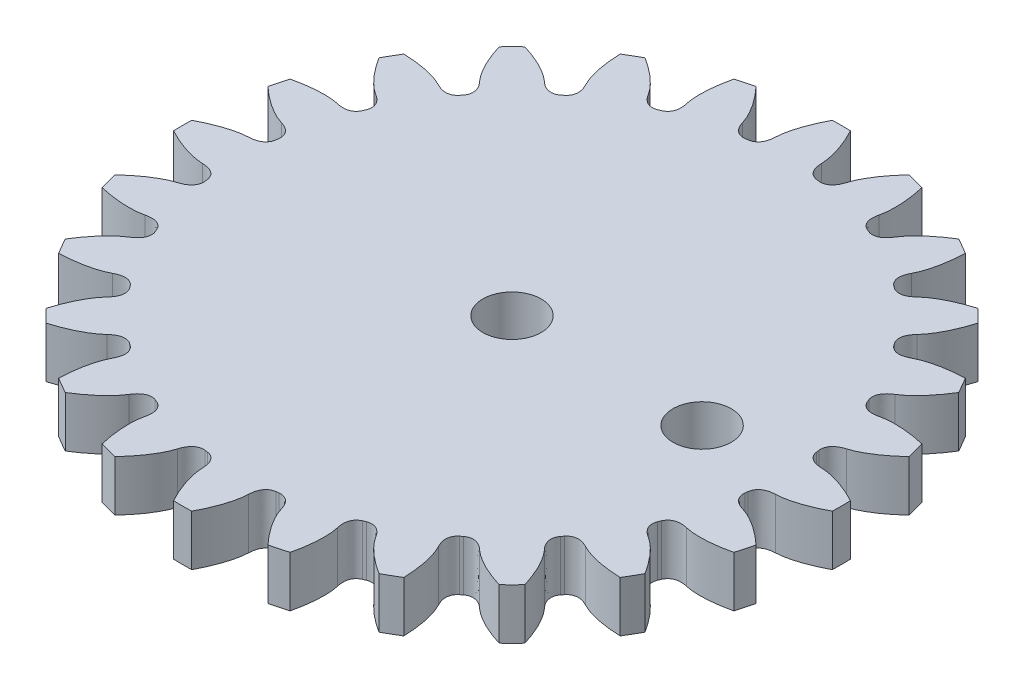
from build123d import *

# Parameters (mm, degrees)
SKETCH_1_R      = 1.15
EXTRUDE_1_DEPTH = 2


with BuildPart() as part:
    # Эскиз1 → Бобышка-Вытянуть1 (new body)
    with BuildSketch(Plane(origin=(0, 0, 0), x_dir=(1, 0, 0), z_dir=(0, 1, 0))):
        with BuildLine():
            add(Edge.make_bspline(
                [(0.905776829, 11.30170004), (0.903153797, 11.364174343), (0.897985909, 11.426330365), (0.890273167, 11.488168106), (0.882433861, 11.551020594), (0.871236283, 11.61359405), (0.858868063, 11.675739131), (0.846302347, 11.73887655), (0.831417931, 11.801647657), (0.815287884, 11.863979043), (0.798904868, 11.927287976), (0.780635548, 11.990183506), (0.761176822, 12.052620709), (0.741417879, 12.116021219), (0.720022631, 12.178974672), (0.697502256, 12.241450826), (0.67463984, 12.304875873), (0.650308122, 12.367826515), (0.624909495, 12.430281414), (0.599130965, 12.493670489), (0.572004587, 12.556561325), (0.543862193, 12.618938569), (0.515305116, 12.682234954), (0.485493692, 12.745011445), (0.45471074, 12.807257013), (0.423480821, 12.870406383), (0.391153926, 12.933013083), (0.357730054, 12.995077114)],
                knots=[0, 0, 0, 0, 1, 1, 1, 2, 2, 2, 3, 3, 3, 4, 4, 4, 5, 5, 5, 6, 6, 6, 7, 7, 7, 8, 8, 8, 9, 9, 9, 9], degree=3))
            ThreePointArc((0.357730054, 12.995077114), (0, 13), (-0.357730054, 12.995077114))
            add(Edge.make_bspline(
                [(-0.905776829, 11.30170004), (-0.903153797, 11.364174343), (-0.897985909, 11.426330365), (-0.890273167, 11.488168106), (-0.882433861, 11.551020594), (-0.871236283, 11.61359405), (-0.858868063, 11.675739131), (-0.846302347, 11.73887655), (-0.831417931, 11.801647657), (-0.815287884, 11.863979043), (-0.798904868, 11.927287976), (-0.780635548, 11.990183506), (-0.761176822, 12.052620709), (-0.741417879, 12.116021219), (-0.720022631, 12.178974672), (-0.697502256, 12.241450826), (-0.67463984, 12.304875873), (-0.650308122, 12.367826515), (-0.624909495, 12.430281414), (-0.599130965, 12.493670489), (-0.572004587, 12.556561325), (-0.543862193, 12.618938569), (-0.515305116, 12.682234954), (-0.485493692, 12.745011445), (-0.45471074, 12.807257013), (-0.423480821, 12.870406383), (-0.391153926, 12.933013083), (-0.357730054, 12.995077114)],
                knots=[0, 0, 0, 0, 1, 1, 1, 2, 2, 2, 3, 3, 3, 4, 4, 4, 5, 5, 5, 6, 6, 6, 7, 7, 7, 8, 8, 8, 9, 9, 9, 9], degree=3))
            add(Edge.make_bspline(
                [(-0.905776829, 11.30170004), (-0.905771657, 11.23039326), (-0.913828063, 11.160800255), (-0.929946047, 11.092921025), (-0.939606651, 11.052236386), (-0.951337627, 11.011263415), (-0.96761603, 10.972714088), (-0.979860318, 10.943718059), (-0.994015249, 10.915028809), (-1.010665897, 10.888305341), (-1.024787349, 10.865641106), (-1.040586182, 10.843617085), (-1.057994763, 10.823361181), (-1.073764387, 10.8050123), (-1.090989796, 10.787535026), (-1.10932187, 10.771741608), (-1.126572142, 10.756880182), (-1.145069758, 10.743071473), (-1.164321541, 10.730911074), (-1.182867326, 10.719196619), (-1.202457761, 10.708685073), (-1.222516171, 10.6998039), (-1.242144834, 10.691113003), (-1.262615206, 10.683752451), (-1.283298802, 10.67800565), (-1.303777222, 10.672315856), (-1.324670017, 10.668115352), (-1.345977185, 10.665404138)],
                knots=[0, 0, 0, 0, 1, 1, 1, 2, 2, 2, 3, 3, 3, 4, 4, 4, 5, 5, 5, 6, 6, 6, 7, 7, 7, 8, 8, 8, 9, 9, 9, 9], degree=3))
            ThreePointArc((-1.345977185, 10.665404138), (-1.403156566, 10.65803226), (-1.46029559, 10.650353834))
            add(Edge.make_bspline(
                [(-2.05018198, 11.151036243), (-2.031731423, 11.082157845), (-2.005937537, 11.017021315), (-1.972800323, 10.955626655), (-1.952938937, 10.91882866), (-1.931003099, 10.882288009), (-1.905302069, 10.849265379), (-1.88597027, 10.824426421), (-1.864872333, 10.800378299), (-1.8418725, 10.778874916), (-1.822366288, 10.760637847), (-1.801405552, 10.743453315), (-1.77934754, 10.728393287), (-1.759366213, 10.714751107), (-1.738204295, 10.702327621), (-1.716409234, 10.69181704), (-1.69590033, 10.681926704), (-1.674459048, 10.673376051), (-1.652715911, 10.666612735), (-1.631770134, 10.660097443), (-1.610126638, 10.655014447), (-1.588453086, 10.651627391), (-1.567243883, 10.648312902), (-1.545565971, 10.646501276), (-1.52409977, 10.646303601), (-1.502846508, 10.646107887), (-1.481578448, 10.647457965), (-1.46029559, 10.650353834)],
                knots=[0, 0, 0, 0, 1, 1, 1, 2, 2, 2, 3, 3, 3, 4, 4, 4, 5, 5, 5, 6, 6, 6, 7, 7, 7, 8, 8, 8, 9, 9, 9, 9], degree=3))
            add(Edge.make_bspline(
                [(-2.05018198, 11.151036243), (-2.068885174, 11.210702895), (-2.089964133, 11.269403455), (-2.113418854, 11.327137921), (-2.137258464, 11.385819801), (-2.164269696, 11.443362972), (-2.192300809, 11.50018938), (-2.220779525, 11.557923196), (-2.251403125, 11.614703059), (-2.283116104, 11.670735792), (-2.31532644, 11.727647289), (-2.349251809, 11.783671257), (-2.384207432, 11.838944675), (-2.419702365, 11.895070875), (-2.45666214, 11.950341743), (-2.494585171, 12.004860372), (-2.533084179, 12.060207035), (-2.572879639, 12.114715173), (-2.613577346, 12.168468325), (-2.654883793, 12.223025495), (-2.697363208, 12.276752555), (-2.740691092, 12.329720558), (-2.784657421, 12.383469055), (-2.829700796, 12.436390725), (-2.875545183, 12.488548112), (-2.922055228, 12.541462822), (-2.969484417, 12.593569434), (-3.017832751, 12.64486795)],
                knots=[0, 0, 0, 0, 1, 1, 1, 2, 2, 2, 3, 3, 3, 4, 4, 4, 5, 5, 5, 6, 6, 6, 7, 7, 7, 8, 8, 8, 9, 9, 9, 9], degree=3))
            ThreePointArc((-3.017832751, 12.64486795), (-3.364647586, 12.557035742), (-3.708914148, 12.459693248))
            add(Edge.make_bspline(
                [(-3.800008445, 10.682171655), (-3.813644329, 10.743196089), (-3.824739696, 10.804571744), (-3.833294544, 10.866298619), (-3.841989776, 10.929038422), (-3.847368949, 10.992377886), (-3.851506497, 11.055606556), (-3.855710113, 11.119844866), (-3.857579229, 11.184329469), (-3.85813135, 11.248711729), (-3.85869213, 11.314103698), (-3.857323882, 11.379584563), (-3.854688134, 11.444930559), (-3.85201172, 11.51128474), (-3.847639049, 11.577630603), (-3.842056056, 11.643806636), (-3.836388268, 11.710987756), (-3.829178458, 11.778090919), (-3.820809786, 11.844991368), (-3.812315939, 11.912892486), (-3.802391216, 11.980661192), (-3.791352169, 12.048196771), (-3.78015046, 12.116727499), (-3.767602588, 12.185080697), (-3.753978878, 12.253172513), (-3.740157352, 12.322253018), (-3.725135776, 12.391093263), (-3.708914148, 12.459693248)],
                knots=[0, 0, 0, 0, 1, 1, 1, 2, 2, 2, 3, 3, 3, 4, 4, 4, 5, 5, 5, 6, 6, 6, 7, 7, 7, 8, 8, 8, 9, 9, 9, 9], degree=3))
            add(Edge.make_bspline(
                [(-3.800008445, 10.682171655), (-3.781547896, 10.613295934), (-3.771317792, 10.543989102), (-3.769318131, 10.474251159), (-3.768119598, 10.432452467), (-3.768846266, 10.389839417), (-3.774592696, 10.348390465), (-3.778915046, 10.317213397), (-3.785162334, 10.285838144), (-3.794329082, 10.255715751), (-3.802103423, 10.23016888), (-3.811663687, 10.204806271), (-3.823236471, 10.180734898), (-3.833719719, 10.158929761), (-3.845834734, 10.137589747), (-3.859454521, 10.117589786), (-3.872270584, 10.098770052), (-3.886563952, 10.080644328), (-3.902012404, 10.063915557), (-3.916894333, 10.047800259), (-3.933096651, 10.032576508), (-3.95017297, 10.018806455), (-3.966883434, 10.005331422), (-3.984751244, 9.992923552), (-4.003242682, 9.98201926), (-4.02155069, 9.971223136), (-4.040644409, 9.961758307), (-4.060523839, 9.953624775)],
                knots=[0, 0, 0, 0, 1, 1, 1, 2, 2, 2, 3, 3, 3, 4, 4, 4, 5, 5, 5, 6, 6, 6, 7, 7, 7, 8, 8, 8, 9, 9, 9, 9], degree=3))
            ThreePointArc((-4.060523839, 9.953624775), (-4.113846898, 9.931704974), (-4.167051634, 9.909499517))
            add(Edge.make_bspline(
                [(-4.866424275, 10.240447755), (-4.830775365, 10.178691686), (-4.78900181, 10.122450579), (-4.741103611, 10.071724433), (-4.712394964, 10.041320804), (-4.681749155, 10.011702659), (-4.648376981, 9.986457164), (-4.623275101, 9.96746801), (-4.596671947, 9.949699856), (-4.568890329, 9.934881978), (-4.545328675, 9.922314901), (-4.520634474, 9.911140955), (-4.495430249, 9.902303119), (-4.472598913, 9.894297334), (-4.448942635, 9.887774275), (-4.425169884, 9.883262811), (-4.402799996, 9.879017574), (-4.379876237, 9.876307689), (-4.357123505, 9.875402366), (-4.335205155, 9.874530243), (-4.312983568, 9.875222195), (-4.29117189, 9.877560078), (-4.26982752, 9.879847873), (-4.248419382, 9.883708634), (-4.227633462, 9.889073556), (-4.207053733, 9.89438526), (-4.18685979, 9.901193914), (-4.167051634, 9.909499517)],
                knots=[0, 0, 0, 0, 1, 1, 1, 2, 2, 2, 3, 3, 3, 4, 4, 4, 5, 5, 5, 6, 6, 6, 7, 7, 7, 8, 8, 8, 9, 9, 9, 9], degree=3))
            add(Edge.make_bspline(
                [(-4.866424275, 10.240447755), (-4.89993304, 10.293240572), (-4.935486573, 10.344485323), (-4.973084874, 10.394182006), (-5.011300156, 10.444694204), (-5.052284271, 10.493285618), (-5.094068004, 10.540920727), (-5.136518943, 10.589316478), (-5.180794779, 10.636235643), (-5.225929503, 10.682151183), (-5.271772077, 10.72878682), (-5.319041538, 10.774121286), (-5.36711189, 10.818464127), (-5.415923891, 10.863491108), (-5.465929446, 10.907312773), (-5.51667074, 10.950158522), (-5.568182697, 10.993655017), (-5.620729904, 11.036006012), (-5.67395321, 11.077394228), (-5.727972608, 11.119401513), (-5.782910159, 11.160303386), (-5.838470809, 11.200252466), (-5.894850156, 11.240790204), (-5.952055852, 11.280250529), (-6.009837454, 11.318765296), (-6.068458042, 11.357839295), (-6.127757305, 11.39589484), (-6.187735242, 11.432931932)],
                knots=[0, 0, 0, 0, 1, 1, 1, 2, 2, 2, 3, 3, 3, 4, 4, 4, 5, 5, 5, 6, 6, 6, 7, 7, 7, 8, 8, 8, 9, 9, 9, 9], degree=3))
            ThreePointArc((-6.187735242, 11.432931932), (-6.5, 11.258330249), (-6.807341872, 11.075201878))
            add(Edge.make_bspline(
                [(-6.435275764, 9.334670926), (-6.464241303, 9.390086775), (-6.490843792, 9.446499413), (-6.515083232, 9.503908839), (-6.539720437, 9.562260343), (-6.561309779, 9.622049335), (-6.581671127, 9.682052664), (-6.602357607, 9.743014131), (-6.620852878, 9.804817712), (-6.63804954, 9.866863299), (-6.655515899, 9.929881951), (-6.671141968, 9.993485738), (-6.685508819, 10.057287305), (-6.700097328, 10.122073229), (-6.713045225, 10.187290142), (-6.724780086, 10.252656266), (-6.736693176, 10.319015177), (-6.747096611, 10.385697891), (-6.756328205, 10.452484734), (-6.765697881, 10.520270548), (-6.773651166, 10.588298798), (-6.78046776, 10.656390273), (-6.787384798, 10.725485089), (-6.792955594, 10.794756837), (-6.797419559, 10.864054556), (-6.801948341, 10.934358474), (-6.805255778, 11.004740914), (-6.807341872, 11.075201878)],
                knots=[0, 0, 0, 0, 1, 1, 1, 2, 2, 2, 3, 3, 3, 4, 4, 4, 5, 5, 5, 6, 6, 6, 7, 7, 7, 8, 8, 8, 9, 9, 9, 9], degree=3))
            add(Edge.make_bspline(
                [(-6.435275764, 9.334670926), (-6.399617895, 9.272920029), (-6.371798445, 9.208622516), (-6.351817413, 9.141778386), (-6.339841422, 9.101714154), (-6.32951426, 9.060365032), (-6.324337108, 9.018841134), (-6.320442957, 8.987607692), (-6.318356862, 8.955684607), (-6.319415012, 8.924216081), (-6.320312431, 8.897527551), (-6.322982611, 8.870554774), (-6.327930932, 8.844308356), (-6.332413387, 8.820532946), (-6.338592391, 8.796784479), (-6.346571724, 8.773940941), (-6.354080185, 8.752445432), (-6.363195236, 8.731237931), (-6.373787569, 8.711080826), (-6.383991463, 8.691662917), (-6.395701505, 8.672764433), (-6.40863201, 8.655043907), (-6.421285484, 8.637703038), (-6.435333069, 8.621093427), (-6.450372188, 8.605774754), (-6.465262123, 8.590608037), (-6.481255562, 8.576523897), (-6.498352504, 8.563522332)],
                knots=[0, 0, 0, 0, 1, 1, 1, 2, 2, 2, 3, 3, 3, 4, 4, 4, 5, 5, 5, 6, 6, 6, 7, 7, 7, 8, 8, 8, 9, 9, 9, 9], degree=3))
            ThreePointArc((-6.498352504, 8.563522332), (-6.544185362, 8.528548408), (-6.589829995, 8.493329185))
            add(Edge.make_bspline(
                [(-7.351027799, 8.631989675), (-7.300609948, 8.581564511), (-7.245703523, 8.538051564), (-7.186308524, 8.501450836), (-7.150709061, 8.47951353), (-7.113441743, 8.458836318), (-7.074672683, 8.443088397), (-7.045511375, 8.431243127), (-7.015215964, 8.420965811), (-6.984545833, 8.413843251), (-6.958534424, 8.407802592), (-6.931789628, 8.403400719), (-6.905156815, 8.401387358), (-6.881031389, 8.399563548), (-6.856492887, 8.399385452), (-6.83236252, 8.401180553), (-6.80965612, 8.402869722), (-6.786812099, 8.40618528), (-6.764600332, 8.411199646), (-6.74320311, 8.416030126), (-6.721917795, 8.42244987), (-6.701454421, 8.430353369), (-6.681429467, 8.438087539), (-6.661750033, 8.447357581), (-6.64306092, 8.45791949), (-6.624557198, 8.468376628), (-6.606813556, 8.480179859), (-6.589829995, 8.493329185)],
                knots=[0, 0, 0, 0, 1, 1, 1, 2, 2, 2, 3, 3, 3, 4, 4, 4, 5, 5, 5, 6, 6, 6, 7, 7, 7, 8, 8, 8, 9, 9, 9, 9], degree=3))
            add(Edge.make_bspline(
                [(-7.351027799, 8.631989675), (-7.397058566, 8.674310914), (-7.444663759, 8.714607611), (-7.493843377, 8.752879765), (-7.543830025, 8.791779958), (-7.595994023, 8.828108191), (-7.648682883, 8.863305747), (-7.702213083, 8.89906534), (-7.75712383, 8.932926344), (-7.812604442, 8.965595625), (-7.868955159, 8.998777259), (-7.926347375, 9.030332754), (-7.984256542, 9.060723127), (-8.043059155, 9.091582375), (-8.102702693, 9.120968463), (-8.162804316, 9.149221466), (-8.223818766, 9.177903577), (-8.285536715, 9.20521128), (-8.347658539, 9.231414022), (-8.410709557, 9.258008693), (-8.474361339, 9.283297984), (-8.538368389, 9.307505679), (-8.603318594, 9.332070078), (-8.668788137, 9.355379901), (-8.734569235, 9.37762733), (-8.801305469, 9.40019779), (-8.868433658, 9.421608846), (-8.935953802, 9.441860497)],
                knots=[0, 0, 0, 0, 1, 1, 1, 2, 2, 2, 3, 3, 3, 4, 4, 4, 5, 5, 5, 6, 6, 6, 7, 7, 7, 8, 8, 8, 9, 9, 9, 9], degree=3))
            ThreePointArc((-8.935953802, 9.441860497), (-9.192388155, 9.192388155), (-9.441860497, 8.935953802))
            add(Edge.make_bspline(
                [(-8.631989675, 7.351027799), (-8.674310914, 7.397058566), (-8.714607611, 7.444663759), (-8.752879765, 7.493843377), (-8.791779958, 7.543830025), (-8.828108191, 7.595994023), (-8.863305747, 7.648682883), (-8.89906534, 7.702213083), (-8.932926344, 7.75712383), (-8.965595625, 7.812604442), (-8.998777259, 7.868955159), (-9.030332754, 7.926347375), (-9.060723127, 7.984256542), (-9.091582375, 8.043059155), (-9.120968463, 8.102702693), (-9.149221466, 8.162804316), (-9.177903577, 8.223818766), (-9.20521128, 8.285536715), (-9.231414022, 8.347658539), (-9.258008693, 8.410709557), (-9.283297984, 8.474361339), (-9.307505679, 8.538368389), (-9.332070078, 8.603318594), (-9.355379901, 8.668788137), (-9.37762733, 8.734569235), (-9.40019779, 8.801305469), (-9.421608846, 8.868433658), (-9.441860497, 8.935953802)],
                knots=[0, 0, 0, 0, 1, 1, 1, 2, 2, 2, 3, 3, 3, 4, 4, 4, 5, 5, 5, 6, 6, 6, 7, 7, 7, 8, 8, 8, 9, 9, 9, 9], degree=3))
            add(Edge.make_bspline(
                [(-8.631989675, 7.351027799), (-8.581564511, 7.300609948), (-8.538051564, 7.245703523), (-8.501450836, 7.186308524), (-8.47951353, 7.150709061), (-8.458836318, 7.113441743), (-8.443088397, 7.074672683), (-8.431243127, 7.045511375), (-8.420965811, 7.015215964), (-8.413843251, 6.984545833), (-8.407802592, 6.958534424), (-8.403400719, 6.931789628), (-8.401387358, 6.905156815), (-8.399563548, 6.881031389), (-8.399385452, 6.856492887), (-8.401180553, 6.83236252), (-8.402869722, 6.80965612), (-8.40618528, 6.786812099), (-8.411199646, 6.764600332), (-8.416030126, 6.74320311), (-8.42244987, 6.721917795), (-8.430353369, 6.701454421), (-8.438087539, 6.681429467), (-8.447357581, 6.661750033), (-8.45791949, 6.64306092), (-8.468376628, 6.624557198), (-8.480179859, 6.606813556), (-8.493329185, 6.589829995)],
                knots=[0, 0, 0, 0, 1, 1, 1, 2, 2, 2, 3, 3, 3, 4, 4, 4, 5, 5, 5, 6, 6, 6, 7, 7, 7, 8, 8, 8, 9, 9, 9, 9], degree=3))
            ThreePointArc((-8.493329185, 6.589829995), (-8.528548408, 6.544185362), (-8.563522332, 6.498352504))
            add(Edge.make_bspline(
                [(-9.334670926, 6.435275764), (-9.272920029, 6.399617895), (-9.208622516, 6.371798445), (-9.141778386, 6.351817413), (-9.101714154, 6.339841422), (-9.060365032, 6.32951426), (-9.018841134, 6.324337108), (-8.987607692, 6.320442957), (-8.955684607, 6.318356862), (-8.924216081, 6.319415012), (-8.897527551, 6.320312431), (-8.870554774, 6.322982611), (-8.844308356, 6.327930932), (-8.820532946, 6.332413387), (-8.796784479, 6.338592391), (-8.773940941, 6.346571724), (-8.752445432, 6.354080185), (-8.731237931, 6.363195236), (-8.711080826, 6.373787569), (-8.691662917, 6.383991463), (-8.672764433, 6.395701505), (-8.655043907, 6.40863201), (-8.637703038, 6.421285484), (-8.621093427, 6.435333069), (-8.605774754, 6.450372188), (-8.590608037, 6.465262123), (-8.576523897, 6.481255562), (-8.563522332, 6.498352504)],
                knots=[0, 0, 0, 0, 1, 1, 1, 2, 2, 2, 3, 3, 3, 4, 4, 4, 5, 5, 5, 6, 6, 6, 7, 7, 7, 8, 8, 8, 9, 9, 9, 9], degree=3))
            add(Edge.make_bspline(
                [(-9.334670926, 6.435275764), (-9.390086775, 6.464241303), (-9.446499413, 6.490843792), (-9.503908839, 6.515083232), (-9.562260343, 6.539720437), (-9.622049335, 6.561309779), (-9.682052664, 6.581671127), (-9.743014131, 6.602357607), (-9.804817712, 6.620852878), (-9.866863299, 6.63804954), (-9.929881951, 6.655515899), (-9.993485738, 6.671141968), (-10.057287305, 6.685508819), (-10.122073229, 6.700097328), (-10.187290142, 6.713045225), (-10.252656266, 6.724780086), (-10.319015177, 6.736693176), (-10.385697891, 6.747096611), (-10.452484734, 6.756328205), (-10.520270548, 6.765697881), (-10.588298798, 6.773651166), (-10.656390273, 6.78046776), (-10.725485089, 6.787384798), (-10.794756837, 6.792955594), (-10.864054556, 6.797419559), (-10.934358474, 6.801948341), (-11.004740914, 6.805255778), (-11.075201878, 6.807341872)],
                knots=[0, 0, 0, 0, 1, 1, 1, 2, 2, 2, 3, 3, 3, 4, 4, 4, 5, 5, 5, 6, 6, 6, 7, 7, 7, 8, 8, 8, 9, 9, 9, 9], degree=3))
            ThreePointArc((-11.075201878, 6.807341872), (-11.258330249, 6.5), (-11.432931932, 6.187735242))
            add(Edge.make_bspline(
                [(-10.240447755, 4.866424275), (-10.293240572, 4.89993304), (-10.344485323, 4.935486573), (-10.394182006, 4.973084874), (-10.444694204, 5.011300156), (-10.493285618, 5.052284271), (-10.540920727, 5.094068004), (-10.589316478, 5.136518943), (-10.636235643, 5.180794779), (-10.682151183, 5.225929503), (-10.72878682, 5.271772077), (-10.774121286, 5.319041538), (-10.818464127, 5.36711189), (-10.863491108, 5.415923891), (-10.907312773, 5.465929446), (-10.950158522, 5.51667074), (-10.993655017, 5.568182697), (-11.036006012, 5.620729904), (-11.077394228, 5.67395321), (-11.119401513, 5.727972608), (-11.160303386, 5.782910159), (-11.200252466, 5.838470809), (-11.240790204, 5.894850156), (-11.280250529, 5.952055852), (-11.318765296, 6.009837454), (-11.357839295, 6.068458042), (-11.39589484, 6.127757305), (-11.432931932, 6.187735242)],
                knots=[0, 0, 0, 0, 1, 1, 1, 2, 2, 2, 3, 3, 3, 4, 4, 4, 5, 5, 5, 6, 6, 6, 7, 7, 7, 8, 8, 8, 9, 9, 9, 9], degree=3))
            add(Edge.make_bspline(
                [(-10.240447755, 4.866424275), (-10.178691686, 4.830775365), (-10.122450579, 4.78900181), (-10.071724433, 4.741103611), (-10.041320804, 4.712394964), (-10.011702659, 4.681749155), (-9.986457164, 4.648376981), (-9.96746801, 4.623275101), (-9.949699856, 4.596671947), (-9.934881978, 4.568890329), (-9.922314901, 4.545328675), (-9.911140955, 4.520634474), (-9.902303119, 4.495430249), (-9.894297334, 4.472598913), (-9.887774275, 4.448942635), (-9.883262811, 4.425169884), (-9.879017574, 4.402799996), (-9.876307689, 4.379876237), (-9.875402366, 4.357123505), (-9.874530243, 4.335205155), (-9.875222195, 4.312983568), (-9.877560078, 4.29117189), (-9.879847873, 4.26982752), (-9.883708634, 4.248419382), (-9.889073556, 4.227633462), (-9.89438526, 4.207053733), (-9.901193914, 4.18685979), (-9.909499517, 4.167051634)],
                knots=[0, 0, 0, 0, 1, 1, 1, 2, 2, 2, 3, 3, 3, 4, 4, 4, 5, 5, 5, 6, 6, 6, 7, 7, 7, 8, 8, 8, 9, 9, 9, 9], degree=3))
            ThreePointArc((-9.909499517, 4.167051634), (-9.931704974, 4.113846898), (-9.953624775, 4.060523839))
            add(Edge.make_bspline(
                [(-10.682171655, 3.800008445), (-10.613295934, 3.781547896), (-10.543989102, 3.771317792), (-10.474251159, 3.769318131), (-10.432452467, 3.768119598), (-10.389839417, 3.768846266), (-10.348390465, 3.774592696), (-10.317213397, 3.778915046), (-10.285838144, 3.785162334), (-10.255715751, 3.794329082), (-10.23016888, 3.802103423), (-10.204806271, 3.811663687), (-10.180734898, 3.823236471), (-10.158929761, 3.833719719), (-10.137589747, 3.845834734), (-10.117589786, 3.859454521), (-10.098770052, 3.872270584), (-10.080644328, 3.886563952), (-10.063915557, 3.902012404), (-10.047800259, 3.916894333), (-10.032576508, 3.933096651), (-10.018806455, 3.95017297), (-10.005331422, 3.966883434), (-9.992923552, 3.984751244), (-9.98201926, 4.003242682), (-9.971223136, 4.02155069), (-9.961758307, 4.040644409), (-9.953624775, 4.060523839)],
                knots=[0, 0, 0, 0, 1, 1, 1, 2, 2, 2, 3, 3, 3, 4, 4, 4, 5, 5, 5, 6, 6, 6, 7, 7, 7, 8, 8, 8, 9, 9, 9, 9], degree=3))
            add(Edge.make_bspline(
                [(-10.682171655, 3.800008445), (-10.743196089, 3.813644329), (-10.804571744, 3.824739696), (-10.866298619, 3.833294544), (-10.929038422, 3.841989776), (-10.992377886, 3.847368949), (-11.055606556, 3.851506497), (-11.119844866, 3.855710113), (-11.184329469, 3.857579229), (-11.248711729, 3.85813135), (-11.314103698, 3.85869213), (-11.379584563, 3.857323882), (-11.444930559, 3.854688134), (-11.51128474, 3.85201172), (-11.577630603, 3.847639049), (-11.643806636, 3.842056056), (-11.710987756, 3.836388268), (-11.778090919, 3.829178458), (-11.844991368, 3.820809786), (-11.912892486, 3.812315939), (-11.980661192, 3.802391216), (-12.048196771, 3.791352169), (-12.116727499, 3.78015046), (-12.185080697, 3.767602588), (-12.253172513, 3.753978878), (-12.322253018, 3.740157352), (-12.391093263, 3.725135776), (-12.459693248, 3.708914148)],
                knots=[0, 0, 0, 0, 1, 1, 1, 2, 2, 2, 3, 3, 3, 4, 4, 4, 5, 5, 5, 6, 6, 6, 7, 7, 7, 8, 8, 8, 9, 9, 9, 9], degree=3))
            ThreePointArc((-12.459693248, 3.708914148), (-12.557035742, 3.364647586), (-12.64486795, 3.017832751))
            add(Edge.make_bspline(
                [(-11.151036243, 2.05018198), (-11.210702895, 2.068885174), (-11.269403455, 2.089964133), (-11.327137921, 2.113418854), (-11.385819801, 2.137258464), (-11.443362972, 2.164269696), (-11.50018938, 2.192300809), (-11.557923196, 2.220779525), (-11.614703059, 2.251403125), (-11.670735792, 2.283116104), (-11.727647289, 2.31532644), (-11.783671257, 2.349251809), (-11.838944675, 2.384207432), (-11.895070875, 2.419702365), (-11.950341743, 2.45666214), (-12.004860372, 2.494585171), (-12.060207035, 2.533084179), (-12.114715173, 2.572879639), (-12.168468325, 2.613577346), (-12.223025495, 2.654883793), (-12.276752555, 2.697363208), (-12.329720558, 2.740691092), (-12.383469055, 2.784657421), (-12.436390725, 2.829700796), (-12.488548112, 2.875545183), (-12.541462822, 2.922055228), (-12.593569434, 2.969484417), (-12.64486795, 3.017832751)],
                knots=[0, 0, 0, 0, 1, 1, 1, 2, 2, 2, 3, 3, 3, 4, 4, 4, 5, 5, 5, 6, 6, 6, 7, 7, 7, 8, 8, 8, 9, 9, 9, 9], degree=3))
            add(Edge.make_bspline(
                [(-11.151036243, 2.05018198), (-11.082157845, 2.031731423), (-11.017021315, 2.005937537), (-10.955626655, 1.972800323), (-10.91882866, 1.952938937), (-10.882288009, 1.931003099), (-10.849265379, 1.905302069), (-10.824426421, 1.88597027), (-10.800378299, 1.864872333), (-10.778874916, 1.8418725), (-10.760637847, 1.822366288), (-10.743453315, 1.801405552), (-10.728393287, 1.77934754), (-10.714751107, 1.759366213), (-10.702327621, 1.738204295), (-10.69181704, 1.716409234), (-10.681926704, 1.69590033), (-10.673376051, 1.674459048), (-10.666612735, 1.652715911), (-10.660097443, 1.631770134), (-10.655014447, 1.610126638), (-10.651627391, 1.588453086), (-10.648312902, 1.567243883), (-10.646501276, 1.545565971), (-10.646303601, 1.52409977), (-10.646107887, 1.502846508), (-10.647457965, 1.481578448), (-10.650353834, 1.46029559)],
                knots=[0, 0, 0, 0, 1, 1, 1, 2, 2, 2, 3, 3, 3, 4, 4, 4, 5, 5, 5, 6, 6, 6, 7, 7, 7, 8, 8, 8, 9, 9, 9, 9], degree=3))
            ThreePointArc((-10.650353834, 1.46029559), (-10.65803226, 1.403156566), (-10.665404138, 1.345977185))
            add(Edge.make_bspline(
                [(-11.30170004, 0.905776829), (-11.23039326, 0.905771657), (-11.160800255, 0.913828063), (-11.092921025, 0.929946047), (-11.052236386, 0.939606651), (-11.011263415, 0.951337627), (-10.972714088, 0.96761603), (-10.943718059, 0.979860318), (-10.915028809, 0.994015249), (-10.888305341, 1.010665897), (-10.865641106, 1.024787349), (-10.843617085, 1.040586182), (-10.823361181, 1.057994763), (-10.8050123, 1.073764387), (-10.787535026, 1.090989796), (-10.771741608, 1.10932187), (-10.756880182, 1.126572142), (-10.743071473, 1.145069758), (-10.730911074, 1.164321541), (-10.719196619, 1.182867326), (-10.708685073, 1.202457761), (-10.6998039, 1.222516171), (-10.691113003, 1.242144834), (-10.683752451, 1.262615206), (-10.67800565, 1.283298802), (-10.672315856, 1.303777222), (-10.668115352, 1.324670017), (-10.665404138, 1.345977185)],
                knots=[0, 0, 0, 0, 1, 1, 1, 2, 2, 2, 3, 3, 3, 4, 4, 4, 5, 5, 5, 6, 6, 6, 7, 7, 7, 8, 8, 8, 9, 9, 9, 9], degree=3))
            add(Edge.make_bspline(
                [(-11.30170004, 0.905776829), (-11.364174343, 0.903153797), (-11.426330365, 0.897985909), (-11.488168106, 0.890273167), (-11.551020594, 0.882433861), (-11.61359405, 0.871236283), (-11.675739131, 0.858868063), (-11.73887655, 0.846302347), (-11.801647657, 0.831417931), (-11.863979043, 0.815287884), (-11.927287976, 0.798904868), (-11.990183506, 0.780635548), (-12.052620709, 0.761176822), (-12.116021219, 0.741417879), (-12.178974672, 0.720022631), (-12.241450826, 0.697502256), (-12.304875873, 0.67463984), (-12.367826515, 0.650308122), (-12.430281414, 0.624909495), (-12.493670489, 0.599130965), (-12.556561325, 0.572004587), (-12.618938569, 0.543862193), (-12.682234954, 0.515305116), (-12.745011445, 0.485493692), (-12.807257013, 0.45471074), (-12.870406383, 0.423480821), (-12.933013083, 0.391153926), (-12.995077114, 0.357730054)],
                knots=[0, 0, 0, 0, 1, 1, 1, 2, 2, 2, 3, 3, 3, 4, 4, 4, 5, 5, 5, 6, 6, 6, 7, 7, 7, 8, 8, 8, 9, 9, 9, 9], degree=3))
            ThreePointArc((-12.995077114, 0.357730054), (-13, 0), (-12.995077114, -0.357730054))
            add(Edge.make_bspline(
                [(-11.30170004, -0.905776829), (-11.364174343, -0.903153797), (-11.426330365, -0.897985909), (-11.488168106, -0.890273167), (-11.551020594, -0.882433861), (-11.61359405, -0.871236283), (-11.675739131, -0.858868063), (-11.73887655, -0.846302347), (-11.801647657, -0.831417931), (-11.863979043, -0.815287884), (-11.927287976, -0.798904868), (-11.990183506, -0.780635548), (-12.052620709, -0.761176822), (-12.116021219, -0.741417879), (-12.178974672, -0.720022631), (-12.241450826, -0.697502256), (-12.304875873, -0.67463984), (-12.367826515, -0.650308122), (-12.430281414, -0.624909495), (-12.493670489, -0.599130965), (-12.556561325, -0.572004587), (-12.618938569, -0.543862193), (-12.682234954, -0.515305116), (-12.745011445, -0.485493692), (-12.807257013, -0.45471074), (-12.870406383, -0.423480821), (-12.933013083, -0.391153926), (-12.995077114, -0.357730054)],
                knots=[0, 0, 0, 0, 1, 1, 1, 2, 2, 2, 3, 3, 3, 4, 4, 4, 5, 5, 5, 6, 6, 6, 7, 7, 7, 8, 8, 8, 9, 9, 9, 9], degree=3))
            add(Edge.make_bspline(
                [(-11.30170004, -0.905776829), (-11.23039326, -0.905771657), (-11.160800255, -0.913828063), (-11.092921025, -0.929946047), (-11.052236386, -0.939606651), (-11.011263415, -0.951337627), (-10.972714088, -0.96761603), (-10.943718059, -0.979860318), (-10.915028809, -0.994015249), (-10.888305341, -1.010665897), (-10.865641106, -1.024787349), (-10.843617085, -1.040586182), (-10.823361181, -1.057994763), (-10.8050123, -1.073764387), (-10.787535026, -1.090989796), (-10.771741608, -1.10932187), (-10.756880182, -1.126572142), (-10.743071473, -1.145069758), (-10.730911074, -1.164321541), (-10.719196619, -1.182867326), (-10.708685073, -1.202457761), (-10.6998039, -1.222516171), (-10.691113003, -1.242144834), (-10.683752451, -1.262615206), (-10.67800565, -1.283298802), (-10.672315856, -1.303777222), (-10.668115352, -1.324670017), (-10.665404138, -1.345977185)],
                knots=[0, 0, 0, 0, 1, 1, 1, 2, 2, 2, 3, 3, 3, 4, 4, 4, 5, 5, 5, 6, 6, 6, 7, 7, 7, 8, 8, 8, 9, 9, 9, 9], degree=3))
            ThreePointArc((-10.665404138, -1.345977185), (-10.65803226, -1.403156566), (-10.650353834, -1.46029559))
            add(Edge.make_bspline(
                [(-11.151036243, -2.05018198), (-11.082157845, -2.031731423), (-11.017021315, -2.005937537), (-10.955626655, -1.972800323), (-10.91882866, -1.952938937), (-10.882288009, -1.931003099), (-10.849265379, -1.905302069), (-10.824426421, -1.88597027), (-10.800378299, -1.864872333), (-10.778874916, -1.8418725), (-10.760637847, -1.822366288), (-10.743453315, -1.801405552), (-10.728393287, -1.77934754), (-10.714751107, -1.759366213), (-10.702327621, -1.738204295), (-10.69181704, -1.716409234), (-10.681926704, -1.69590033), (-10.673376051, -1.674459048), (-10.666612735, -1.652715911), (-10.660097443, -1.631770134), (-10.655014447, -1.610126638), (-10.651627391, -1.588453086), (-10.648312902, -1.567243883), (-10.646501276, -1.545565971), (-10.646303601, -1.52409977), (-10.646107887, -1.502846508), (-10.647457965, -1.481578448), (-10.650353834, -1.46029559)],
                knots=[0, 0, 0, 0, 1, 1, 1, 2, 2, 2, 3, 3, 3, 4, 4, 4, 5, 5, 5, 6, 6, 6, 7, 7, 7, 8, 8, 8, 9, 9, 9, 9], degree=3))
            add(Edge.make_bspline(
                [(-11.151036243, -2.05018198), (-11.210702895, -2.068885174), (-11.269403455, -2.089964133), (-11.327137921, -2.113418854), (-11.385819801, -2.137258464), (-11.443362972, -2.164269696), (-11.50018938, -2.192300809), (-11.557923196, -2.220779525), (-11.614703059, -2.251403125), (-11.670735792, -2.283116104), (-11.727647289, -2.31532644), (-11.783671257, -2.349251809), (-11.838944675, -2.384207432), (-11.895070875, -2.419702365), (-11.950341743, -2.45666214), (-12.004860372, -2.494585171), (-12.060207035, -2.533084179), (-12.114715173, -2.572879639), (-12.168468325, -2.613577346), (-12.223025495, -2.654883793), (-12.276752555, -2.697363208), (-12.329720558, -2.740691092), (-12.383469055, -2.784657421), (-12.436390725, -2.829700796), (-12.488548112, -2.875545183), (-12.541462822, -2.922055228), (-12.593569434, -2.969484417), (-12.64486795, -3.017832751)],
                knots=[0, 0, 0, 0, 1, 1, 1, 2, 2, 2, 3, 3, 3, 4, 4, 4, 5, 5, 5, 6, 6, 6, 7, 7, 7, 8, 8, 8, 9, 9, 9, 9], degree=3))
            ThreePointArc((-12.64486795, -3.017832751), (-12.557035742, -3.364647586), (-12.459693248, -3.708914148))
            add(Edge.make_bspline(
                [(-10.682171655, -3.800008445), (-10.743196089, -3.813644329), (-10.804571744, -3.824739696), (-10.866298619, -3.833294544), (-10.929038422, -3.841989776), (-10.992377886, -3.847368949), (-11.055606556, -3.851506497), (-11.119844866, -3.855710113), (-11.184329469, -3.857579229), (-11.248711729, -3.85813135), (-11.314103698, -3.85869213), (-11.379584563, -3.857323882), (-11.444930559, -3.854688134), (-11.51128474, -3.85201172), (-11.577630603, -3.847639049), (-11.643806636, -3.842056056), (-11.710987756, -3.836388268), (-11.778090919, -3.829178458), (-11.844991368, -3.820809786), (-11.912892486, -3.812315939), (-11.980661192, -3.802391216), (-12.048196771, -3.791352169), (-12.116727499, -3.78015046), (-12.185080697, -3.767602588), (-12.253172513, -3.753978878), (-12.322253018, -3.740157352), (-12.391093263, -3.725135776), (-12.459693248, -3.708914148)],
                knots=[0, 0, 0, 0, 1, 1, 1, 2, 2, 2, 3, 3, 3, 4, 4, 4, 5, 5, 5, 6, 6, 6, 7, 7, 7, 8, 8, 8, 9, 9, 9, 9], degree=3))
            add(Edge.make_bspline(
                [(-10.682171655, -3.800008445), (-10.613295934, -3.781547896), (-10.543989102, -3.771317792), (-10.474251159, -3.769318131), (-10.432452467, -3.768119598), (-10.389839417, -3.768846266), (-10.348390465, -3.774592696), (-10.317213397, -3.778915046), (-10.285838144, -3.785162334), (-10.255715751, -3.794329082), (-10.23016888, -3.802103423), (-10.204806271, -3.811663687), (-10.180734898, -3.823236471), (-10.158929761, -3.833719719), (-10.137589747, -3.845834734), (-10.117589786, -3.859454521), (-10.098770052, -3.872270584), (-10.080644328, -3.886563952), (-10.063915557, -3.902012404), (-10.047800259, -3.916894333), (-10.032576508, -3.933096651), (-10.018806455, -3.95017297), (-10.005331422, -3.966883434), (-9.992923552, -3.984751244), (-9.98201926, -4.003242682), (-9.971223136, -4.02155069), (-9.961758307, -4.040644409), (-9.953624775, -4.060523839)],
                knots=[0, 0, 0, 0, 1, 1, 1, 2, 2, 2, 3, 3, 3, 4, 4, 4, 5, 5, 5, 6, 6, 6, 7, 7, 7, 8, 8, 8, 9, 9, 9, 9], degree=3))
            ThreePointArc((-9.953624775, -4.060523839), (-9.931704974, -4.113846898), (-9.909499517, -4.167051634))
            add(Edge.make_bspline(
                [(-10.240447755, -4.866424275), (-10.178691686, -4.830775365), (-10.122450579, -4.78900181), (-10.071724433, -4.741103611), (-10.041320804, -4.712394964), (-10.011702659, -4.681749155), (-9.986457164, -4.648376981), (-9.96746801, -4.623275101), (-9.949699856, -4.596671947), (-9.934881978, -4.568890329), (-9.922314901, -4.545328675), (-9.911140955, -4.520634474), (-9.902303119, -4.495430249), (-9.894297334, -4.472598913), (-9.887774275, -4.448942635), (-9.883262811, -4.425169884), (-9.879017574, -4.402799996), (-9.876307689, -4.379876237), (-9.875402366, -4.357123505), (-9.874530243, -4.335205155), (-9.875222195, -4.312983568), (-9.877560078, -4.29117189), (-9.879847873, -4.26982752), (-9.883708634, -4.248419382), (-9.889073556, -4.227633462), (-9.89438526, -4.207053733), (-9.901193914, -4.18685979), (-9.909499517, -4.167051634)],
                knots=[0, 0, 0, 0, 1, 1, 1, 2, 2, 2, 3, 3, 3, 4, 4, 4, 5, 5, 5, 6, 6, 6, 7, 7, 7, 8, 8, 8, 9, 9, 9, 9], degree=3))
            add(Edge.make_bspline(
                [(-10.240447755, -4.866424275), (-10.293240572, -4.89993304), (-10.344485323, -4.935486573), (-10.394182006, -4.973084874), (-10.444694204, -5.011300156), (-10.493285618, -5.052284271), (-10.540920727, -5.094068004), (-10.589316478, -5.136518943), (-10.636235643, -5.180794779), (-10.682151183, -5.225929503), (-10.72878682, -5.271772077), (-10.774121286, -5.319041538), (-10.818464127, -5.36711189), (-10.863491108, -5.415923891), (-10.907312773, -5.465929446), (-10.950158522, -5.51667074), (-10.993655017, -5.568182697), (-11.036006012, -5.620729904), (-11.077394228, -5.67395321), (-11.119401513, -5.727972608), (-11.160303386, -5.782910159), (-11.200252466, -5.838470809), (-11.240790204, -5.894850156), (-11.280250529, -5.952055852), (-11.318765296, -6.009837454), (-11.357839295, -6.068458042), (-11.39589484, -6.127757305), (-11.432931932, -6.187735242)],
                knots=[0, 0, 0, 0, 1, 1, 1, 2, 2, 2, 3, 3, 3, 4, 4, 4, 5, 5, 5, 6, 6, 6, 7, 7, 7, 8, 8, 8, 9, 9, 9, 9], degree=3))
            ThreePointArc((-11.432931932, -6.187735242), (-11.258330249, -6.5), (-11.075201878, -6.807341872))
            add(Edge.make_bspline(
                [(-9.334670926, -6.435275764), (-9.390086775, -6.464241303), (-9.446499413, -6.490843792), (-9.503908839, -6.515083232), (-9.562260343, -6.539720437), (-9.622049335, -6.561309779), (-9.682052664, -6.581671127), (-9.743014131, -6.602357607), (-9.804817712, -6.620852878), (-9.866863299, -6.63804954), (-9.929881951, -6.655515899), (-9.993485738, -6.671141968), (-10.057287305, -6.685508819), (-10.122073229, -6.700097328), (-10.187290142, -6.713045225), (-10.252656266, -6.724780086), (-10.319015177, -6.736693176), (-10.385697891, -6.747096611), (-10.452484734, -6.756328205), (-10.520270548, -6.765697881), (-10.588298798, -6.773651166), (-10.656390273, -6.78046776), (-10.725485089, -6.787384798), (-10.794756837, -6.792955594), (-10.864054556, -6.797419559), (-10.934358474, -6.801948341), (-11.004740914, -6.805255778), (-11.075201878, -6.807341872)],
                knots=[0, 0, 0, 0, 1, 1, 1, 2, 2, 2, 3, 3, 3, 4, 4, 4, 5, 5, 5, 6, 6, 6, 7, 7, 7, 8, 8, 8, 9, 9, 9, 9], degree=3))
            add(Edge.make_bspline(
                [(-9.334670926, -6.435275764), (-9.272920029, -6.399617895), (-9.208622516, -6.371798445), (-9.141778386, -6.351817413), (-9.101714154, -6.339841422), (-9.060365032, -6.32951426), (-9.018841134, -6.324337108), (-8.987607692, -6.320442957), (-8.955684607, -6.318356862), (-8.924216081, -6.319415012), (-8.897527551, -6.320312431), (-8.870554774, -6.322982611), (-8.844308356, -6.327930932), (-8.820532946, -6.332413387), (-8.796784479, -6.338592391), (-8.773940941, -6.346571724), (-8.752445432, -6.354080185), (-8.731237931, -6.363195236), (-8.711080826, -6.373787569), (-8.691662917, -6.383991463), (-8.672764433, -6.395701505), (-8.655043907, -6.40863201), (-8.637703038, -6.421285484), (-8.621093427, -6.435333069), (-8.605774754, -6.450372188), (-8.590608037, -6.465262123), (-8.576523897, -6.481255562), (-8.563522332, -6.498352504)],
                knots=[0, 0, 0, 0, 1, 1, 1, 2, 2, 2, 3, 3, 3, 4, 4, 4, 5, 5, 5, 6, 6, 6, 7, 7, 7, 8, 8, 8, 9, 9, 9, 9], degree=3))
            ThreePointArc((-8.563522332, -6.498352504), (-8.528548408, -6.544185362), (-8.493329185, -6.589829995))
            add(Edge.make_bspline(
                [(-8.631989675, -7.351027799), (-8.581564511, -7.300609948), (-8.538051564, -7.245703523), (-8.501450836, -7.186308524), (-8.47951353, -7.150709061), (-8.458836318, -7.113441743), (-8.443088397, -7.074672683), (-8.431243127, -7.045511375), (-8.420965811, -7.015215964), (-8.413843251, -6.984545833), (-8.407802592, -6.958534424), (-8.403400719, -6.931789628), (-8.401387358, -6.905156815), (-8.399563548, -6.881031389), (-8.399385452, -6.856492887), (-8.401180553, -6.83236252), (-8.402869722, -6.80965612), (-8.40618528, -6.786812099), (-8.411199646, -6.764600332), (-8.416030126, -6.74320311), (-8.42244987, -6.721917795), (-8.430353369, -6.701454421), (-8.438087539, -6.681429467), (-8.447357581, -6.661750033), (-8.45791949, -6.64306092), (-8.468376628, -6.624557198), (-8.480179859, -6.606813556), (-8.493329185, -6.589829995)],
                knots=[0, 0, 0, 0, 1, 1, 1, 2, 2, 2, 3, 3, 3, 4, 4, 4, 5, 5, 5, 6, 6, 6, 7, 7, 7, 8, 8, 8, 9, 9, 9, 9], degree=3))
            add(Edge.make_bspline(
                [(-8.631989675, -7.351027799), (-8.674310914, -7.397058566), (-8.714607611, -7.444663759), (-8.752879765, -7.493843377), (-8.791779958, -7.543830025), (-8.828108191, -7.595994023), (-8.863305747, -7.648682883), (-8.89906534, -7.702213083), (-8.932926344, -7.75712383), (-8.965595625, -7.812604442), (-8.998777259, -7.868955159), (-9.030332754, -7.926347375), (-9.060723127, -7.984256542), (-9.091582375, -8.043059155), (-9.120968463, -8.102702693), (-9.149221466, -8.162804316), (-9.177903577, -8.223818766), (-9.20521128, -8.285536715), (-9.231414022, -8.347658539), (-9.258008693, -8.410709557), (-9.283297984, -8.474361339), (-9.307505679, -8.538368389), (-9.332070078, -8.603318594), (-9.355379901, -8.668788137), (-9.37762733, -8.734569235), (-9.40019779, -8.801305469), (-9.421608846, -8.868433658), (-9.441860497, -8.935953802)],
                knots=[0, 0, 0, 0, 1, 1, 1, 2, 2, 2, 3, 3, 3, 4, 4, 4, 5, 5, 5, 6, 6, 6, 7, 7, 7, 8, 8, 8, 9, 9, 9, 9], degree=3))
            ThreePointArc((-9.441860497, -8.935953802), (-9.192388155, -9.192388155), (-8.935953802, -9.441860497))
            add(Edge.make_bspline(
                [(-7.351027799, -8.631989675), (-7.397058566, -8.674310914), (-7.444663759, -8.714607611), (-7.493843377, -8.752879765), (-7.543830025, -8.791779958), (-7.595994023, -8.828108191), (-7.648682883, -8.863305747), (-7.702213083, -8.89906534), (-7.75712383, -8.932926344), (-7.812604442, -8.965595625), (-7.868955159, -8.998777259), (-7.926347375, -9.030332754), (-7.984256542, -9.060723127), (-8.043059155, -9.091582375), (-8.102702693, -9.120968463), (-8.162804316, -9.149221466), (-8.223818766, -9.177903577), (-8.285536715, -9.20521128), (-8.347658539, -9.231414022), (-8.410709557, -9.258008693), (-8.474361339, -9.283297984), (-8.538368389, -9.307505679), (-8.603318594, -9.332070078), (-8.668788137, -9.355379901), (-8.734569235, -9.37762733), (-8.801305469, -9.40019779), (-8.868433658, -9.421608846), (-8.935953802, -9.441860497)],
                knots=[0, 0, 0, 0, 1, 1, 1, 2, 2, 2, 3, 3, 3, 4, 4, 4, 5, 5, 5, 6, 6, 6, 7, 7, 7, 8, 8, 8, 9, 9, 9, 9], degree=3))
            add(Edge.make_bspline(
                [(-7.351027799, -8.631989675), (-7.300609948, -8.581564511), (-7.245703523, -8.538051564), (-7.186308524, -8.501450836), (-7.150709061, -8.47951353), (-7.113441743, -8.458836318), (-7.074672683, -8.443088397), (-7.045511375, -8.431243127), (-7.015215964, -8.420965811), (-6.984545833, -8.413843251), (-6.958534424, -8.407802592), (-6.931789628, -8.403400719), (-6.905156815, -8.401387358), (-6.881031389, -8.399563548), (-6.856492887, -8.399385452), (-6.83236252, -8.401180553), (-6.80965612, -8.402869722), (-6.786812099, -8.40618528), (-6.764600332, -8.411199646), (-6.74320311, -8.416030126), (-6.721917795, -8.42244987), (-6.701454421, -8.430353369), (-6.681429467, -8.438087539), (-6.661750033, -8.447357581), (-6.64306092, -8.45791949), (-6.624557198, -8.468376628), (-6.606813556, -8.480179859), (-6.589829995, -8.493329185)],
                knots=[0, 0, 0, 0, 1, 1, 1, 2, 2, 2, 3, 3, 3, 4, 4, 4, 5, 5, 5, 6, 6, 6, 7, 7, 7, 8, 8, 8, 9, 9, 9, 9], degree=3))
            ThreePointArc((-6.589829995, -8.493329185), (-6.544185362, -8.528548408), (-6.498352504, -8.563522332))
            add(Edge.make_bspline(
                [(-6.435275764, -9.334670926), (-6.399617895, -9.272920029), (-6.371798445, -9.208622516), (-6.351817413, -9.141778386), (-6.339841422, -9.101714154), (-6.32951426, -9.060365032), (-6.324337108, -9.018841134), (-6.320442957, -8.987607692), (-6.318356862, -8.955684607), (-6.319415012, -8.924216081), (-6.320312431, -8.897527551), (-6.322982611, -8.870554774), (-6.327930932, -8.844308356), (-6.332413387, -8.820532946), (-6.338592391, -8.796784479), (-6.346571724, -8.773940941), (-6.354080185, -8.752445432), (-6.363195236, -8.731237931), (-6.373787569, -8.711080826), (-6.383991463, -8.691662917), (-6.395701505, -8.672764433), (-6.40863201, -8.655043907), (-6.421285484, -8.637703038), (-6.435333069, -8.621093427), (-6.450372188, -8.605774754), (-6.465262123, -8.590608037), (-6.481255562, -8.576523897), (-6.498352504, -8.563522332)],
                knots=[0, 0, 0, 0, 1, 1, 1, 2, 2, 2, 3, 3, 3, 4, 4, 4, 5, 5, 5, 6, 6, 6, 7, 7, 7, 8, 8, 8, 9, 9, 9, 9], degree=3))
            add(Edge.make_bspline(
                [(-6.435275764, -9.334670926), (-6.464241303, -9.390086775), (-6.490843792, -9.446499413), (-6.515083232, -9.503908839), (-6.539720437, -9.562260343), (-6.561309779, -9.622049335), (-6.581671127, -9.682052664), (-6.602357607, -9.743014131), (-6.620852878, -9.804817712), (-6.63804954, -9.866863299), (-6.655515899, -9.929881951), (-6.671141968, -9.993485738), (-6.685508819, -10.057287305), (-6.700097328, -10.122073229), (-6.713045225, -10.187290142), (-6.724780086, -10.252656266), (-6.736693176, -10.319015177), (-6.747096611, -10.385697891), (-6.756328205, -10.452484734), (-6.765697881, -10.520270548), (-6.773651166, -10.588298798), (-6.78046776, -10.656390273), (-6.787384798, -10.725485089), (-6.792955594, -10.794756837), (-6.797419559, -10.864054556), (-6.801948341, -10.934358474), (-6.805255778, -11.004740914), (-6.807341872, -11.075201878)],
                knots=[0, 0, 0, 0, 1, 1, 1, 2, 2, 2, 3, 3, 3, 4, 4, 4, 5, 5, 5, 6, 6, 6, 7, 7, 7, 8, 8, 8, 9, 9, 9, 9], degree=3))
            ThreePointArc((-6.807341872, -11.075201878), (-6.5, -11.258330249), (-6.187735242, -11.432931932))
            add(Edge.make_bspline(
                [(-4.866424275, -10.240447755), (-4.89993304, -10.293240572), (-4.935486573, -10.344485323), (-4.973084874, -10.394182006), (-5.011300156, -10.444694204), (-5.052284271, -10.493285618), (-5.094068004, -10.540920727), (-5.136518943, -10.589316478), (-5.180794779, -10.636235643), (-5.225929503, -10.682151183), (-5.271772077, -10.72878682), (-5.319041538, -10.774121286), (-5.36711189, -10.818464127), (-5.415923891, -10.863491108), (-5.465929446, -10.907312773), (-5.51667074, -10.950158522), (-5.568182697, -10.993655017), (-5.620729904, -11.036006012), (-5.67395321, -11.077394228), (-5.727972608, -11.119401513), (-5.782910159, -11.160303386), (-5.838470809, -11.200252466), (-5.894850156, -11.240790204), (-5.952055852, -11.280250529), (-6.009837454, -11.318765296), (-6.068458042, -11.357839295), (-6.127757305, -11.39589484), (-6.187735242, -11.432931932)],
                knots=[0, 0, 0, 0, 1, 1, 1, 2, 2, 2, 3, 3, 3, 4, 4, 4, 5, 5, 5, 6, 6, 6, 7, 7, 7, 8, 8, 8, 9, 9, 9, 9], degree=3))
            add(Edge.make_bspline(
                [(-4.866424275, -10.240447755), (-4.830775365, -10.178691686), (-4.78900181, -10.122450579), (-4.741103611, -10.071724433), (-4.712394964, -10.041320804), (-4.681749155, -10.011702659), (-4.648376981, -9.986457164), (-4.623275101, -9.96746801), (-4.596671947, -9.949699856), (-4.568890329, -9.934881978), (-4.545328675, -9.922314901), (-4.520634474, -9.911140955), (-4.495430249, -9.902303119), (-4.472598913, -9.894297334), (-4.448942635, -9.887774275), (-4.425169884, -9.883262811), (-4.402799996, -9.879017574), (-4.379876237, -9.876307689), (-4.357123505, -9.875402366), (-4.335205155, -9.874530243), (-4.312983568, -9.875222195), (-4.29117189, -9.877560078), (-4.26982752, -9.879847873), (-4.248419382, -9.883708634), (-4.227633462, -9.889073556), (-4.207053733, -9.89438526), (-4.18685979, -9.901193914), (-4.167051634, -9.909499517)],
                knots=[0, 0, 0, 0, 1, 1, 1, 2, 2, 2, 3, 3, 3, 4, 4, 4, 5, 5, 5, 6, 6, 6, 7, 7, 7, 8, 8, 8, 9, 9, 9, 9], degree=3))
            ThreePointArc((-4.167051634, -9.909499517), (-4.113846898, -9.931704974), (-4.060523839, -9.953624775))
            add(Edge.make_bspline(
                [(-3.800008445, -10.682171655), (-3.781547896, -10.613295934), (-3.771317792, -10.543989102), (-3.769318131, -10.474251159), (-3.768119598, -10.432452467), (-3.768846266, -10.389839417), (-3.774592696, -10.348390465), (-3.778915046, -10.317213397), (-3.785162334, -10.285838144), (-3.794329082, -10.255715751), (-3.802103423, -10.23016888), (-3.811663687, -10.204806271), (-3.823236471, -10.180734898), (-3.833719719, -10.158929761), (-3.845834734, -10.137589747), (-3.859454521, -10.117589786), (-3.872270584, -10.098770052), (-3.886563952, -10.080644328), (-3.902012404, -10.063915557), (-3.916894333, -10.047800259), (-3.933096651, -10.032576508), (-3.95017297, -10.018806455), (-3.966883434, -10.005331422), (-3.984751244, -9.992923552), (-4.003242682, -9.98201926), (-4.02155069, -9.971223136), (-4.040644409, -9.961758307), (-4.060523839, -9.953624775)],
                knots=[0, 0, 0, 0, 1, 1, 1, 2, 2, 2, 3, 3, 3, 4, 4, 4, 5, 5, 5, 6, 6, 6, 7, 7, 7, 8, 8, 8, 9, 9, 9, 9], degree=3))
            add(Edge.make_bspline(
                [(-3.800008445, -10.682171655), (-3.813644329, -10.743196089), (-3.824739696, -10.804571744), (-3.833294544, -10.866298619), (-3.841989776, -10.929038422), (-3.847368949, -10.992377886), (-3.851506497, -11.055606556), (-3.855710113, -11.119844866), (-3.857579229, -11.184329469), (-3.85813135, -11.248711729), (-3.85869213, -11.314103698), (-3.857323882, -11.379584563), (-3.854688134, -11.444930559), (-3.85201172, -11.51128474), (-3.847639049, -11.577630603), (-3.842056056, -11.643806636), (-3.836388268, -11.710987756), (-3.829178458, -11.778090919), (-3.820809786, -11.844991368), (-3.812315939, -11.912892486), (-3.802391216, -11.980661192), (-3.791352169, -12.048196771), (-3.78015046, -12.116727499), (-3.767602588, -12.185080697), (-3.753978878, -12.253172513), (-3.740157352, -12.322253018), (-3.725135776, -12.391093263), (-3.708914148, -12.459693248)],
                knots=[0, 0, 0, 0, 1, 1, 1, 2, 2, 2, 3, 3, 3, 4, 4, 4, 5, 5, 5, 6, 6, 6, 7, 7, 7, 8, 8, 8, 9, 9, 9, 9], degree=3))
            ThreePointArc((-3.708914148, -12.459693248), (-3.364647586, -12.557035742), (-3.017832751, -12.64486795))
            add(Edge.make_bspline(
                [(-2.05018198, -11.151036243), (-2.068885174, -11.210702895), (-2.089964133, -11.269403455), (-2.113418854, -11.327137921), (-2.137258464, -11.385819801), (-2.164269696, -11.443362972), (-2.192300809, -11.50018938), (-2.220779525, -11.557923196), (-2.251403125, -11.614703059), (-2.283116104, -11.670735792), (-2.31532644, -11.727647289), (-2.349251809, -11.783671257), (-2.384207432, -11.838944675), (-2.419702365, -11.895070875), (-2.45666214, -11.950341743), (-2.494585171, -12.004860372), (-2.533084179, -12.060207035), (-2.572879639, -12.114715173), (-2.613577346, -12.168468325), (-2.654883793, -12.223025495), (-2.697363208, -12.276752555), (-2.740691092, -12.329720558), (-2.784657421, -12.383469055), (-2.829700796, -12.436390725), (-2.875545183, -12.488548112), (-2.922055228, -12.541462822), (-2.969484417, -12.593569434), (-3.017832751, -12.64486795)],
                knots=[0, 0, 0, 0, 1, 1, 1, 2, 2, 2, 3, 3, 3, 4, 4, 4, 5, 5, 5, 6, 6, 6, 7, 7, 7, 8, 8, 8, 9, 9, 9, 9], degree=3))
            add(Edge.make_bspline(
                [(-2.05018198, -11.151036243), (-2.031731423, -11.082157845), (-2.005937537, -11.017021315), (-1.972800323, -10.955626655), (-1.952938937, -10.91882866), (-1.931003099, -10.882288009), (-1.905302069, -10.849265379), (-1.88597027, -10.824426421), (-1.864872333, -10.800378299), (-1.8418725, -10.778874916), (-1.822366288, -10.760637847), (-1.801405552, -10.743453315), (-1.77934754, -10.728393287), (-1.759366213, -10.714751107), (-1.738204295, -10.702327621), (-1.716409234, -10.69181704), (-1.69590033, -10.681926704), (-1.674459048, -10.673376051), (-1.652715911, -10.666612735), (-1.631770134, -10.660097443), (-1.610126638, -10.655014447), (-1.588453086, -10.651627391), (-1.567243883, -10.648312902), (-1.545565971, -10.646501276), (-1.52409977, -10.646303601), (-1.502846508, -10.646107887), (-1.481578448, -10.647457965), (-1.46029559, -10.650353834)],
                knots=[0, 0, 0, 0, 1, 1, 1, 2, 2, 2, 3, 3, 3, 4, 4, 4, 5, 5, 5, 6, 6, 6, 7, 7, 7, 8, 8, 8, 9, 9, 9, 9], degree=3))
            ThreePointArc((-1.46029559, -10.650353834), (-1.403156566, -10.65803226), (-1.345977185, -10.665404138))
            add(Edge.make_bspline(
                [(-0.905776829, -11.30170004), (-0.905771657, -11.23039326), (-0.913828063, -11.160800255), (-0.929946047, -11.092921025), (-0.939606651, -11.052236386), (-0.951337627, -11.011263415), (-0.96761603, -10.972714088), (-0.979860318, -10.943718059), (-0.994015249, -10.915028809), (-1.010665897, -10.888305341), (-1.024787349, -10.865641106), (-1.040586182, -10.843617085), (-1.057994763, -10.823361181), (-1.073764387, -10.8050123), (-1.090989796, -10.787535026), (-1.10932187, -10.771741608), (-1.126572142, -10.756880182), (-1.145069758, -10.743071473), (-1.164321541, -10.730911074), (-1.182867326, -10.719196619), (-1.202457761, -10.708685073), (-1.222516171, -10.6998039), (-1.242144834, -10.691113003), (-1.262615206, -10.683752451), (-1.283298802, -10.67800565), (-1.303777222, -10.672315856), (-1.324670017, -10.668115352), (-1.345977185, -10.665404138)],
                knots=[0, 0, 0, 0, 1, 1, 1, 2, 2, 2, 3, 3, 3, 4, 4, 4, 5, 5, 5, 6, 6, 6, 7, 7, 7, 8, 8, 8, 9, 9, 9, 9], degree=3))
            add(Edge.make_bspline(
                [(-0.905776829, -11.30170004), (-0.903153797, -11.364174343), (-0.897985909, -11.426330365), (-0.890273167, -11.488168106), (-0.882433861, -11.551020594), (-0.871236283, -11.61359405), (-0.858868063, -11.675739131), (-0.846302347, -11.73887655), (-0.831417931, -11.801647657), (-0.815287884, -11.863979043), (-0.798904868, -11.927287976), (-0.780635548, -11.990183506), (-0.761176822, -12.052620709), (-0.741417879, -12.116021219), (-0.720022631, -12.178974672), (-0.697502256, -12.241450826), (-0.67463984, -12.304875873), (-0.650308122, -12.367826515), (-0.624909495, -12.430281414), (-0.599130965, -12.493670489), (-0.572004587, -12.556561325), (-0.543862193, -12.618938569), (-0.515305116, -12.682234954), (-0.485493692, -12.745011445), (-0.45471074, -12.807257013), (-0.423480821, -12.870406383), (-0.391153926, -12.933013083), (-0.357730054, -12.995077114)],
                knots=[0, 0, 0, 0, 1, 1, 1, 2, 2, 2, 3, 3, 3, 4, 4, 4, 5, 5, 5, 6, 6, 6, 7, 7, 7, 8, 8, 8, 9, 9, 9, 9], degree=3))
            ThreePointArc((-0.357730054, -12.995077114), (0, -13), (0.357730054, -12.995077114))
            add(Edge.make_bspline(
                [(0.905776829, -11.30170004), (0.903153797, -11.364174343), (0.897985909, -11.426330365), (0.890273167, -11.488168106), (0.882433861, -11.551020594), (0.871236283, -11.61359405), (0.858868063, -11.675739131), (0.846302347, -11.73887655), (0.831417931, -11.801647657), (0.815287884, -11.863979043), (0.798904868, -11.927287976), (0.780635548, -11.990183506), (0.761176822, -12.052620709), (0.741417879, -12.116021219), (0.720022631, -12.178974672), (0.697502256, -12.241450826), (0.67463984, -12.304875873), (0.650308122, -12.367826515), (0.624909495, -12.430281414), (0.599130965, -12.493670489), (0.572004587, -12.556561325), (0.543862193, -12.618938569), (0.515305116, -12.682234954), (0.485493692, -12.745011445), (0.45471074, -12.807257013), (0.423480821, -12.870406383), (0.391153926, -12.933013083), (0.357730054, -12.995077114)],
                knots=[0, 0, 0, 0, 1, 1, 1, 2, 2, 2, 3, 3, 3, 4, 4, 4, 5, 5, 5, 6, 6, 6, 7, 7, 7, 8, 8, 8, 9, 9, 9, 9], degree=3))
            add(Edge.make_bspline(
                [(0.905776829, -11.30170004), (0.905771657, -11.23039326), (0.913828063, -11.160800255), (0.929946047, -11.092921025), (0.939606651, -11.052236386), (0.951337627, -11.011263415), (0.96761603, -10.972714088), (0.979860318, -10.943718059), (0.994015249, -10.915028809), (1.010665897, -10.888305341), (1.024787349, -10.865641106), (1.040586182, -10.843617085), (1.057994763, -10.823361181), (1.073764387, -10.8050123), (1.090989796, -10.787535026), (1.10932187, -10.771741608), (1.126572142, -10.756880182), (1.145069758, -10.743071473), (1.164321541, -10.730911074), (1.182867326, -10.719196619), (1.202457761, -10.708685073), (1.222516171, -10.6998039), (1.242144834, -10.691113003), (1.262615206, -10.683752451), (1.283298802, -10.67800565), (1.303777222, -10.672315856), (1.324670017, -10.668115352), (1.345977185, -10.665404138)],
                knots=[0, 0, 0, 0, 1, 1, 1, 2, 2, 2, 3, 3, 3, 4, 4, 4, 5, 5, 5, 6, 6, 6, 7, 7, 7, 8, 8, 8, 9, 9, 9, 9], degree=3))
            ThreePointArc((1.345977185, -10.665404138), (1.403156566, -10.65803226), (1.46029559, -10.650353834))
            add(Edge.make_bspline(
                [(2.05018198, -11.151036243), (2.031731423, -11.082157845), (2.005937537, -11.017021315), (1.972800323, -10.955626655), (1.952938937, -10.91882866), (1.931003099, -10.882288009), (1.905302069, -10.849265379), (1.88597027, -10.824426421), (1.864872333, -10.800378299), (1.8418725, -10.778874916), (1.822366288, -10.760637847), (1.801405552, -10.743453315), (1.77934754, -10.728393287), (1.759366213, -10.714751107), (1.738204295, -10.702327621), (1.716409234, -10.69181704), (1.69590033, -10.681926704), (1.674459048, -10.673376051), (1.652715911, -10.666612735), (1.631770134, -10.660097443), (1.610126638, -10.655014447), (1.588453086, -10.651627391), (1.567243883, -10.648312902), (1.545565971, -10.646501276), (1.52409977, -10.646303601), (1.502846508, -10.646107887), (1.481578448, -10.647457965), (1.46029559, -10.650353834)],
                knots=[0, 0, 0, 0, 1, 1, 1, 2, 2, 2, 3, 3, 3, 4, 4, 4, 5, 5, 5, 6, 6, 6, 7, 7, 7, 8, 8, 8, 9, 9, 9, 9], degree=3))
            add(Edge.make_bspline(
                [(2.05018198, -11.151036243), (2.068885174, -11.210702895), (2.089964133, -11.269403455), (2.113418854, -11.327137921), (2.137258464, -11.385819801), (2.164269696, -11.443362972), (2.192300809, -11.50018938), (2.220779525, -11.557923196), (2.251403125, -11.614703059), (2.283116104, -11.670735792), (2.31532644, -11.727647289), (2.349251809, -11.783671257), (2.384207432, -11.838944675), (2.419702365, -11.895070875), (2.45666214, -11.950341743), (2.494585171, -12.004860372), (2.533084179, -12.060207035), (2.572879639, -12.114715173), (2.613577346, -12.168468325), (2.654883793, -12.223025495), (2.697363208, -12.276752555), (2.740691092, -12.329720558), (2.784657421, -12.383469055), (2.829700796, -12.436390725), (2.875545183, -12.488548112), (2.922055228, -12.541462822), (2.969484417, -12.593569434), (3.017832751, -12.64486795)],
                knots=[0, 0, 0, 0, 1, 1, 1, 2, 2, 2, 3, 3, 3, 4, 4, 4, 5, 5, 5, 6, 6, 6, 7, 7, 7, 8, 8, 8, 9, 9, 9, 9], degree=3))
            ThreePointArc((3.017832751, -12.64486795), (3.364647586, -12.557035742), (3.708914148, -12.459693248))
            add(Edge.make_bspline(
                [(3.800008445, -10.682171655), (3.813644329, -10.743196089), (3.824739696, -10.804571744), (3.833294544, -10.866298619), (3.841989776, -10.929038422), (3.847368949, -10.992377886), (3.851506497, -11.055606556), (3.855710113, -11.119844866), (3.857579229, -11.184329469), (3.85813135, -11.248711729), (3.85869213, -11.314103698), (3.857323882, -11.379584563), (3.854688134, -11.444930559), (3.85201172, -11.51128474), (3.847639049, -11.577630603), (3.842056056, -11.643806636), (3.836388268, -11.710987756), (3.829178458, -11.778090919), (3.820809786, -11.844991368), (3.812315939, -11.912892486), (3.802391216, -11.980661192), (3.791352169, -12.048196771), (3.78015046, -12.116727499), (3.767602588, -12.185080697), (3.753978878, -12.253172513), (3.740157352, -12.322253018), (3.725135776, -12.391093263), (3.708914148, -12.459693248)],
                knots=[0, 0, 0, 0, 1, 1, 1, 2, 2, 2, 3, 3, 3, 4, 4, 4, 5, 5, 5, 6, 6, 6, 7, 7, 7, 8, 8, 8, 9, 9, 9, 9], degree=3))
            add(Edge.make_bspline(
                [(3.800008445, -10.682171655), (3.781547896, -10.613295934), (3.771317792, -10.543989102), (3.769318131, -10.474251159), (3.768119598, -10.432452467), (3.768846266, -10.389839417), (3.774592696, -10.348390465), (3.778915046, -10.317213397), (3.785162334, -10.285838144), (3.794329082, -10.255715751), (3.802103423, -10.23016888), (3.811663687, -10.204806271), (3.823236471, -10.180734898), (3.833719719, -10.158929761), (3.845834734, -10.137589747), (3.859454521, -10.117589786), (3.872270584, -10.098770052), (3.886563952, -10.080644328), (3.902012404, -10.063915557), (3.916894333, -10.047800259), (3.933096651, -10.032576508), (3.95017297, -10.018806455), (3.966883434, -10.005331422), (3.984751244, -9.992923552), (4.003242682, -9.98201926), (4.02155069, -9.971223136), (4.040644409, -9.961758307), (4.060523839, -9.953624775)],
                knots=[0, 0, 0, 0, 1, 1, 1, 2, 2, 2, 3, 3, 3, 4, 4, 4, 5, 5, 5, 6, 6, 6, 7, 7, 7, 8, 8, 8, 9, 9, 9, 9], degree=3))
            ThreePointArc((4.060523839, -9.953624775), (4.113846898, -9.931704974), (4.167051634, -9.909499517))
            add(Edge.make_bspline(
                [(4.866424275, -10.240447755), (4.830775365, -10.178691686), (4.78900181, -10.122450579), (4.741103611, -10.071724433), (4.712394964, -10.041320804), (4.681749155, -10.011702659), (4.648376981, -9.986457164), (4.623275101, -9.96746801), (4.596671947, -9.949699856), (4.568890329, -9.934881978), (4.545328675, -9.922314901), (4.520634474, -9.911140955), (4.495430249, -9.902303119), (4.472598913, -9.894297334), (4.448942635, -9.887774275), (4.425169884, -9.883262811), (4.402799996, -9.879017574), (4.379876237, -9.876307689), (4.357123505, -9.875402366), (4.335205155, -9.874530243), (4.312983568, -9.875222195), (4.29117189, -9.877560078), (4.26982752, -9.879847873), (4.248419382, -9.883708634), (4.227633462, -9.889073556), (4.207053733, -9.89438526), (4.18685979, -9.901193914), (4.167051634, -9.909499517)],
                knots=[0, 0, 0, 0, 1, 1, 1, 2, 2, 2, 3, 3, 3, 4, 4, 4, 5, 5, 5, 6, 6, 6, 7, 7, 7, 8, 8, 8, 9, 9, 9, 9], degree=3))
            add(Edge.make_bspline(
                [(4.866424275, -10.240447755), (4.89993304, -10.293240572), (4.935486573, -10.344485323), (4.973084874, -10.394182006), (5.011300156, -10.444694204), (5.052284271, -10.493285618), (5.094068004, -10.540920727), (5.136518943, -10.589316478), (5.180794779, -10.636235643), (5.225929503, -10.682151183), (5.271772077, -10.72878682), (5.319041538, -10.774121286), (5.36711189, -10.818464127), (5.415923891, -10.863491108), (5.465929446, -10.907312773), (5.51667074, -10.950158522), (5.568182697, -10.993655017), (5.620729904, -11.036006012), (5.67395321, -11.077394228), (5.727972608, -11.119401513), (5.782910159, -11.160303386), (5.838470809, -11.200252466), (5.894850156, -11.240790204), (5.952055852, -11.280250529), (6.009837454, -11.318765296), (6.068458042, -11.357839295), (6.127757305, -11.39589484), (6.187735242, -11.432931932)],
                knots=[0, 0, 0, 0, 1, 1, 1, 2, 2, 2, 3, 3, 3, 4, 4, 4, 5, 5, 5, 6, 6, 6, 7, 7, 7, 8, 8, 8, 9, 9, 9, 9], degree=3))
            ThreePointArc((6.187735242, -11.432931932), (6.5, -11.258330249), (6.807341872, -11.075201878))
            add(Edge.make_bspline(
                [(6.435275764, -9.334670926), (6.464241303, -9.390086775), (6.490843792, -9.446499413), (6.515083232, -9.503908839), (6.539720437, -9.562260343), (6.561309779, -9.622049335), (6.581671127, -9.682052664), (6.602357607, -9.743014131), (6.620852878, -9.804817712), (6.63804954, -9.866863299), (6.655515899, -9.929881951), (6.671141968, -9.993485738), (6.685508819, -10.057287305), (6.700097328, -10.122073229), (6.713045225, -10.187290142), (6.724780086, -10.252656266), (6.736693176, -10.319015177), (6.747096611, -10.385697891), (6.756328205, -10.452484734), (6.765697881, -10.520270548), (6.773651166, -10.588298798), (6.78046776, -10.656390273), (6.787384798, -10.725485089), (6.792955594, -10.794756837), (6.797419559, -10.864054556), (6.801948341, -10.934358474), (6.805255778, -11.004740914), (6.807341872, -11.075201878)],
                knots=[0, 0, 0, 0, 1, 1, 1, 2, 2, 2, 3, 3, 3, 4, 4, 4, 5, 5, 5, 6, 6, 6, 7, 7, 7, 8, 8, 8, 9, 9, 9, 9], degree=3))
            add(Edge.make_bspline(
                [(6.435275764, -9.334670926), (6.399617895, -9.272920029), (6.371798445, -9.208622516), (6.351817413, -9.141778386), (6.339841422, -9.101714154), (6.32951426, -9.060365032), (6.324337108, -9.018841134), (6.320442957, -8.987607692), (6.318356862, -8.955684607), (6.319415012, -8.924216081), (6.320312431, -8.897527551), (6.322982611, -8.870554774), (6.327930932, -8.844308356), (6.332413387, -8.820532946), (6.338592391, -8.796784479), (6.346571724, -8.773940941), (6.354080185, -8.752445432), (6.363195236, -8.731237931), (6.373787569, -8.711080826), (6.383991463, -8.691662917), (6.395701505, -8.672764433), (6.40863201, -8.655043907), (6.421285484, -8.637703038), (6.435333069, -8.621093427), (6.450372188, -8.605774754), (6.465262123, -8.590608037), (6.481255562, -8.576523897), (6.498352504, -8.563522332)],
                knots=[0, 0, 0, 0, 1, 1, 1, 2, 2, 2, 3, 3, 3, 4, 4, 4, 5, 5, 5, 6, 6, 6, 7, 7, 7, 8, 8, 8, 9, 9, 9, 9], degree=3))
            ThreePointArc((6.498352504, -8.563522332), (6.544185362, -8.528548408), (6.589829995, -8.493329185))
            add(Edge.make_bspline(
                [(7.351027799, -8.631989675), (7.300609948, -8.581564511), (7.245703523, -8.538051564), (7.186308524, -8.501450836), (7.150709061, -8.47951353), (7.113441743, -8.458836318), (7.074672683, -8.443088397), (7.045511375, -8.431243127), (7.015215964, -8.420965811), (6.984545833, -8.413843251), (6.958534424, -8.407802592), (6.931789628, -8.403400719), (6.905156815, -8.401387358), (6.881031389, -8.399563548), (6.856492887, -8.399385452), (6.83236252, -8.401180553), (6.80965612, -8.402869722), (6.786812099, -8.40618528), (6.764600332, -8.411199646), (6.74320311, -8.416030126), (6.721917795, -8.42244987), (6.701454421, -8.430353369), (6.681429467, -8.438087539), (6.661750033, -8.447357581), (6.64306092, -8.45791949), (6.624557198, -8.468376628), (6.606813556, -8.480179859), (6.589829995, -8.493329185)],
                knots=[0, 0, 0, 0, 1, 1, 1, 2, 2, 2, 3, 3, 3, 4, 4, 4, 5, 5, 5, 6, 6, 6, 7, 7, 7, 8, 8, 8, 9, 9, 9, 9], degree=3))
            add(Edge.make_bspline(
                [(7.351027799, -8.631989675), (7.397058566, -8.674310914), (7.444663759, -8.714607611), (7.493843377, -8.752879765), (7.543830025, -8.791779958), (7.595994023, -8.828108191), (7.648682883, -8.863305747), (7.702213083, -8.89906534), (7.75712383, -8.932926344), (7.812604442, -8.965595625), (7.868955159, -8.998777259), (7.926347375, -9.030332754), (7.984256542, -9.060723127), (8.043059155, -9.091582375), (8.102702693, -9.120968463), (8.162804316, -9.149221466), (8.223818766, -9.177903577), (8.285536715, -9.20521128), (8.347658539, -9.231414022), (8.410709557, -9.258008693), (8.474361339, -9.283297984), (8.538368389, -9.307505679), (8.603318594, -9.332070078), (8.668788137, -9.355379901), (8.734569235, -9.37762733), (8.801305469, -9.40019779), (8.868433658, -9.421608846), (8.935953802, -9.441860497)],
                knots=[0, 0, 0, 0, 1, 1, 1, 2, 2, 2, 3, 3, 3, 4, 4, 4, 5, 5, 5, 6, 6, 6, 7, 7, 7, 8, 8, 8, 9, 9, 9, 9], degree=3))
            ThreePointArc((8.935953802, -9.441860497), (9.192388155, -9.192388155), (9.441860497, -8.935953802))
            add(Edge.make_bspline(
                [(8.631989675, -7.351027799), (8.674310914, -7.397058566), (8.714607611, -7.444663759), (8.752879765, -7.493843377), (8.791779958, -7.543830025), (8.828108191, -7.595994023), (8.863305747, -7.648682883), (8.89906534, -7.702213083), (8.932926344, -7.75712383), (8.965595625, -7.812604442), (8.998777259, -7.868955159), (9.030332754, -7.926347375), (9.060723127, -7.984256542), (9.091582375, -8.043059155), (9.120968463, -8.102702693), (9.149221466, -8.162804316), (9.177903577, -8.223818766), (9.20521128, -8.285536715), (9.231414022, -8.347658539), (9.258008693, -8.410709557), (9.283297984, -8.474361339), (9.307505679, -8.538368389), (9.332070078, -8.603318594), (9.355379901, -8.668788137), (9.37762733, -8.734569235), (9.40019779, -8.801305469), (9.421608846, -8.868433658), (9.441860497, -8.935953802)],
                knots=[0, 0, 0, 0, 1, 1, 1, 2, 2, 2, 3, 3, 3, 4, 4, 4, 5, 5, 5, 6, 6, 6, 7, 7, 7, 8, 8, 8, 9, 9, 9, 9], degree=3))
            add(Edge.make_bspline(
                [(8.631989675, -7.351027799), (8.581564511, -7.300609948), (8.538051564, -7.245703523), (8.501450836, -7.186308524), (8.47951353, -7.150709061), (8.458836318, -7.113441743), (8.443088397, -7.074672683), (8.431243127, -7.045511375), (8.420965811, -7.015215964), (8.413843251, -6.984545833), (8.407802592, -6.958534424), (8.403400719, -6.931789628), (8.401387358, -6.905156815), (8.399563548, -6.881031389), (8.399385452, -6.856492887), (8.401180553, -6.83236252), (8.402869722, -6.80965612), (8.40618528, -6.786812099), (8.411199646, -6.764600332), (8.416030126, -6.74320311), (8.42244987, -6.721917795), (8.430353369, -6.701454421), (8.438087539, -6.681429467), (8.447357581, -6.661750033), (8.45791949, -6.64306092), (8.468376628, -6.624557198), (8.480179859, -6.606813556), (8.493329185, -6.589829995)],
                knots=[0, 0, 0, 0, 1, 1, 1, 2, 2, 2, 3, 3, 3, 4, 4, 4, 5, 5, 5, 6, 6, 6, 7, 7, 7, 8, 8, 8, 9, 9, 9, 9], degree=3))
            ThreePointArc((8.493329185, -6.589829995), (8.528548408, -6.544185362), (8.563522332, -6.498352504))
            add(Edge.make_bspline(
                [(9.334670926, -6.435275764), (9.272920029, -6.399617895), (9.208622516, -6.371798445), (9.141778386, -6.351817413), (9.101714154, -6.339841422), (9.060365032, -6.32951426), (9.018841134, -6.324337108), (8.987607692, -6.320442957), (8.955684607, -6.318356862), (8.924216081, -6.319415012), (8.897527551, -6.320312431), (8.870554774, -6.322982611), (8.844308356, -6.327930932), (8.820532946, -6.332413387), (8.796784479, -6.338592391), (8.773940941, -6.346571724), (8.752445432, -6.354080185), (8.731237931, -6.363195236), (8.711080826, -6.373787569), (8.691662917, -6.383991463), (8.672764433, -6.395701505), (8.655043907, -6.40863201), (8.637703038, -6.421285484), (8.621093427, -6.435333069), (8.605774754, -6.450372188), (8.590608037, -6.465262123), (8.576523897, -6.481255562), (8.563522332, -6.498352504)],
                knots=[0, 0, 0, 0, 1, 1, 1, 2, 2, 2, 3, 3, 3, 4, 4, 4, 5, 5, 5, 6, 6, 6, 7, 7, 7, 8, 8, 8, 9, 9, 9, 9], degree=3))
            add(Edge.make_bspline(
                [(9.334670926, -6.435275764), (9.390086775, -6.464241303), (9.446499413, -6.490843792), (9.503908839, -6.515083232), (9.562260343, -6.539720437), (9.622049335, -6.561309779), (9.682052664, -6.581671127), (9.743014131, -6.602357607), (9.804817712, -6.620852878), (9.866863299, -6.63804954), (9.929881951, -6.655515899), (9.993485738, -6.671141968), (10.057287305, -6.685508819), (10.122073229, -6.700097328), (10.187290142, -6.713045225), (10.252656266, -6.724780086), (10.319015177, -6.736693176), (10.385697891, -6.747096611), (10.452484734, -6.756328205), (10.520270548, -6.765697881), (10.588298798, -6.773651166), (10.656390273, -6.78046776), (10.725485089, -6.787384798), (10.794756837, -6.792955594), (10.864054556, -6.797419559), (10.934358474, -6.801948341), (11.004740914, -6.805255778), (11.075201878, -6.807341872)],
                knots=[0, 0, 0, 0, 1, 1, 1, 2, 2, 2, 3, 3, 3, 4, 4, 4, 5, 5, 5, 6, 6, 6, 7, 7, 7, 8, 8, 8, 9, 9, 9, 9], degree=3))
            ThreePointArc((11.075201878, -6.807341872), (11.258330249, -6.5), (11.432931932, -6.187735242))
            add(Edge.make_bspline(
                [(10.240447755, -4.866424275), (10.293240572, -4.89993304), (10.344485323, -4.935486573), (10.394182006, -4.973084874), (10.444694204, -5.011300156), (10.493285618, -5.052284271), (10.540920727, -5.094068004), (10.589316478, -5.136518943), (10.636235643, -5.180794779), (10.682151183, -5.225929503), (10.72878682, -5.271772077), (10.774121286, -5.319041538), (10.818464127, -5.36711189), (10.863491108, -5.415923891), (10.907312773, -5.465929446), (10.950158522, -5.51667074), (10.993655017, -5.568182697), (11.036006012, -5.620729904), (11.077394228, -5.67395321), (11.119401513, -5.727972608), (11.160303386, -5.782910159), (11.200252466, -5.838470809), (11.240790204, -5.894850156), (11.280250529, -5.952055852), (11.318765296, -6.009837454), (11.357839295, -6.068458042), (11.39589484, -6.127757305), (11.432931932, -6.187735242)],
                knots=[0, 0, 0, 0, 1, 1, 1, 2, 2, 2, 3, 3, 3, 4, 4, 4, 5, 5, 5, 6, 6, 6, 7, 7, 7, 8, 8, 8, 9, 9, 9, 9], degree=3))
            add(Edge.make_bspline(
                [(10.240447755, -4.866424275), (10.178691686, -4.830775365), (10.122450579, -4.78900181), (10.071724433, -4.741103611), (10.041320804, -4.712394964), (10.011702659, -4.681749155), (9.986457164, -4.648376981), (9.96746801, -4.623275101), (9.949699856, -4.596671947), (9.934881978, -4.568890329), (9.922314901, -4.545328675), (9.911140955, -4.520634474), (9.902303119, -4.495430249), (9.894297334, -4.472598913), (9.887774275, -4.448942635), (9.883262811, -4.425169884), (9.879017574, -4.402799996), (9.876307689, -4.379876237), (9.875402366, -4.357123505), (9.874530243, -4.335205155), (9.875222195, -4.312983568), (9.877560078, -4.29117189), (9.879847873, -4.26982752), (9.883708634, -4.248419382), (9.889073556, -4.227633462), (9.89438526, -4.207053733), (9.901193914, -4.18685979), (9.909499517, -4.167051634)],
                knots=[0, 0, 0, 0, 1, 1, 1, 2, 2, 2, 3, 3, 3, 4, 4, 4, 5, 5, 5, 6, 6, 6, 7, 7, 7, 8, 8, 8, 9, 9, 9, 9], degree=3))
            ThreePointArc((9.909499517, -4.167051634), (9.931704974, -4.113846898), (9.953624775, -4.060523839))
            add(Edge.make_bspline(
                [(10.682171655, -3.800008445), (10.613295934, -3.781547896), (10.543989102, -3.771317792), (10.474251159, -3.769318131), (10.432452467, -3.768119598), (10.389839417, -3.768846266), (10.348390465, -3.774592696), (10.317213397, -3.778915046), (10.285838144, -3.785162334), (10.255715751, -3.794329082), (10.23016888, -3.802103423), (10.204806271, -3.811663687), (10.180734898, -3.823236471), (10.158929761, -3.833719719), (10.137589747, -3.845834734), (10.117589786, -3.859454521), (10.098770052, -3.872270584), (10.080644328, -3.886563952), (10.063915557, -3.902012404), (10.047800259, -3.916894333), (10.032576508, -3.933096651), (10.018806455, -3.95017297), (10.005331422, -3.966883434), (9.992923552, -3.984751244), (9.98201926, -4.003242682), (9.971223136, -4.02155069), (9.961758307, -4.040644409), (9.953624775, -4.060523839)],
                knots=[0, 0, 0, 0, 1, 1, 1, 2, 2, 2, 3, 3, 3, 4, 4, 4, 5, 5, 5, 6, 6, 6, 7, 7, 7, 8, 8, 8, 9, 9, 9, 9], degree=3))
            add(Edge.make_bspline(
                [(10.682171655, -3.800008445), (10.743196089, -3.813644329), (10.804571744, -3.824739696), (10.866298619, -3.833294544), (10.929038422, -3.841989776), (10.992377886, -3.847368949), (11.055606556, -3.851506497), (11.119844866, -3.855710113), (11.184329469, -3.857579229), (11.248711729, -3.85813135), (11.314103698, -3.85869213), (11.379584563, -3.857323882), (11.444930559, -3.854688134), (11.51128474, -3.85201172), (11.577630603, -3.847639049), (11.643806636, -3.842056056), (11.710987756, -3.836388268), (11.778090919, -3.829178458), (11.844991368, -3.820809786), (11.912892486, -3.812315939), (11.980661192, -3.802391216), (12.048196771, -3.791352169), (12.116727499, -3.78015046), (12.185080697, -3.767602588), (12.253172513, -3.753978878), (12.322253018, -3.740157352), (12.391093263, -3.725135776), (12.459693248, -3.708914148)],
                knots=[0, 0, 0, 0, 1, 1, 1, 2, 2, 2, 3, 3, 3, 4, 4, 4, 5, 5, 5, 6, 6, 6, 7, 7, 7, 8, 8, 8, 9, 9, 9, 9], degree=3))
            ThreePointArc((12.459693248, -3.708914148), (12.557035742, -3.364647586), (12.64486795, -3.017832751))
            add(Edge.make_bspline(
                [(11.151036243, -2.05018198), (11.210702895, -2.068885174), (11.269403455, -2.089964133), (11.327137921, -2.113418854), (11.385819801, -2.137258464), (11.443362972, -2.164269696), (11.50018938, -2.192300809), (11.557923196, -2.220779525), (11.614703059, -2.251403125), (11.670735792, -2.283116104), (11.727647289, -2.31532644), (11.783671257, -2.349251809), (11.838944675, -2.384207432), (11.895070875, -2.419702365), (11.950341743, -2.45666214), (12.004860372, -2.494585171), (12.060207035, -2.533084179), (12.114715173, -2.572879639), (12.168468325, -2.613577346), (12.223025495, -2.654883793), (12.276752555, -2.697363208), (12.329720558, -2.740691092), (12.383469055, -2.784657421), (12.436390725, -2.829700796), (12.488548112, -2.875545183), (12.541462822, -2.922055228), (12.593569434, -2.969484417), (12.64486795, -3.017832751)],
                knots=[0, 0, 0, 0, 1, 1, 1, 2, 2, 2, 3, 3, 3, 4, 4, 4, 5, 5, 5, 6, 6, 6, 7, 7, 7, 8, 8, 8, 9, 9, 9, 9], degree=3))
            add(Edge.make_bspline(
                [(11.151036243, -2.05018198), (11.082157845, -2.031731423), (11.017021315, -2.005937537), (10.955626655, -1.972800323), (10.91882866, -1.952938937), (10.882288009, -1.931003099), (10.849265379, -1.905302069), (10.824426421, -1.88597027), (10.800378299, -1.864872333), (10.778874916, -1.8418725), (10.760637847, -1.822366288), (10.743453315, -1.801405552), (10.728393287, -1.77934754), (10.714751107, -1.759366213), (10.702327621, -1.738204295), (10.69181704, -1.716409234), (10.681926704, -1.69590033), (10.673376051, -1.674459048), (10.666612735, -1.652715911), (10.660097443, -1.631770134), (10.655014447, -1.610126638), (10.651627391, -1.588453086), (10.648312902, -1.567243883), (10.646501276, -1.545565971), (10.646303601, -1.52409977), (10.646107887, -1.502846508), (10.647457965, -1.481578448), (10.650353834, -1.46029559)],
                knots=[0, 0, 0, 0, 1, 1, 1, 2, 2, 2, 3, 3, 3, 4, 4, 4, 5, 5, 5, 6, 6, 6, 7, 7, 7, 8, 8, 8, 9, 9, 9, 9], degree=3))
            ThreePointArc((10.650353834, -1.46029559), (10.65803226, -1.403156566), (10.665404138, -1.345977185))
            add(Edge.make_bspline(
                [(11.30170004, -0.905776829), (11.23039326, -0.905771657), (11.160800255, -0.913828063), (11.092921025, -0.929946047), (11.052236386, -0.939606651), (11.011263415, -0.951337627), (10.972714088, -0.96761603), (10.943718059, -0.979860318), (10.915028809, -0.994015249), (10.888305341, -1.010665897), (10.865641106, -1.024787349), (10.843617085, -1.040586182), (10.823361181, -1.057994763), (10.8050123, -1.073764387), (10.787535026, -1.090989796), (10.771741608, -1.10932187), (10.756880182, -1.126572142), (10.743071473, -1.145069758), (10.730911074, -1.164321541), (10.719196619, -1.182867326), (10.708685073, -1.202457761), (10.6998039, -1.222516171), (10.691113003, -1.242144834), (10.683752451, -1.262615206), (10.67800565, -1.283298802), (10.672315856, -1.303777222), (10.668115352, -1.324670017), (10.665404138, -1.345977185)],
                knots=[0, 0, 0, 0, 1, 1, 1, 2, 2, 2, 3, 3, 3, 4, 4, 4, 5, 5, 5, 6, 6, 6, 7, 7, 7, 8, 8, 8, 9, 9, 9, 9], degree=3))
            add(Edge.make_bspline(
                [(11.30170004, -0.905776829), (11.364174343, -0.903153797), (11.426330365, -0.897985909), (11.488168106, -0.890273167), (11.551020594, -0.882433861), (11.61359405, -0.871236283), (11.675739131, -0.858868063), (11.73887655, -0.846302347), (11.801647657, -0.831417931), (11.863979043, -0.815287884), (11.927287976, -0.798904868), (11.990183506, -0.780635548), (12.052620709, -0.761176822), (12.116021219, -0.741417879), (12.178974672, -0.720022631), (12.241450826, -0.697502256), (12.304875873, -0.67463984), (12.367826515, -0.650308122), (12.430281414, -0.624909495), (12.493670489, -0.599130965), (12.556561325, -0.572004587), (12.618938569, -0.543862193), (12.682234954, -0.515305116), (12.745011445, -0.485493692), (12.807257013, -0.45471074), (12.870406383, -0.423480821), (12.933013083, -0.391153926), (12.995077114, -0.357730054)],
                knots=[0, 0, 0, 0, 1, 1, 1, 2, 2, 2, 3, 3, 3, 4, 4, 4, 5, 5, 5, 6, 6, 6, 7, 7, 7, 8, 8, 8, 9, 9, 9, 9], degree=3))
            ThreePointArc((12.995077114, -0.357730054), (13, 0), (12.995077114, 0.357730054))
            add(Edge.make_bspline(
                [(11.30170004, 0.905776829), (11.364174343, 0.903153797), (11.426330365, 0.897985909), (11.488168106, 0.890273167), (11.551020594, 0.882433861), (11.61359405, 0.871236283), (11.675739131, 0.858868063), (11.73887655, 0.846302347), (11.801647657, 0.831417931), (11.863979043, 0.815287884), (11.927287976, 0.798904868), (11.990183506, 0.780635548), (12.052620709, 0.761176822), (12.116021219, 0.741417879), (12.178974672, 0.720022631), (12.241450826, 0.697502256), (12.304875873, 0.67463984), (12.367826515, 0.650308122), (12.430281414, 0.624909495), (12.493670489, 0.599130965), (12.556561325, 0.572004587), (12.618938569, 0.543862193), (12.682234954, 0.515305116), (12.745011445, 0.485493692), (12.807257013, 0.45471074), (12.870406383, 0.423480821), (12.933013083, 0.391153926), (12.995077114, 0.357730054)],
                knots=[0, 0, 0, 0, 1, 1, 1, 2, 2, 2, 3, 3, 3, 4, 4, 4, 5, 5, 5, 6, 6, 6, 7, 7, 7, 8, 8, 8, 9, 9, 9, 9], degree=3))
            add(Edge.make_bspline(
                [(11.30170004, 0.905776829), (11.23039326, 0.905771657), (11.160800255, 0.913828063), (11.092921025, 0.929946047), (11.052236386, 0.939606651), (11.011263415, 0.951337627), (10.972714088, 0.96761603), (10.943718059, 0.979860318), (10.915028809, 0.994015249), (10.888305341, 1.010665897), (10.865641106, 1.024787349), (10.843617085, 1.040586182), (10.823361181, 1.057994763), (10.8050123, 1.073764387), (10.787535026, 1.090989796), (10.771741608, 1.10932187), (10.756880182, 1.126572142), (10.743071473, 1.145069758), (10.730911074, 1.164321541), (10.719196619, 1.182867326), (10.708685073, 1.202457761), (10.6998039, 1.222516171), (10.691113003, 1.242144834), (10.683752451, 1.262615206), (10.67800565, 1.283298802), (10.672315856, 1.303777222), (10.668115352, 1.324670017), (10.665404138, 1.345977185)],
                knots=[0, 0, 0, 0, 1, 1, 1, 2, 2, 2, 3, 3, 3, 4, 4, 4, 5, 5, 5, 6, 6, 6, 7, 7, 7, 8, 8, 8, 9, 9, 9, 9], degree=3))
            ThreePointArc((10.665404138, 1.345977185), (10.65803226, 1.403156566), (10.650353834, 1.46029559))
            add(Edge.make_bspline(
                [(11.151036243, 2.05018198), (11.082157845, 2.031731423), (11.017021315, 2.005937537), (10.955626655, 1.972800323), (10.91882866, 1.952938937), (10.882288009, 1.931003099), (10.849265379, 1.905302069), (10.824426421, 1.88597027), (10.800378299, 1.864872333), (10.778874916, 1.8418725), (10.760637847, 1.822366288), (10.743453315, 1.801405552), (10.728393287, 1.77934754), (10.714751107, 1.759366213), (10.702327621, 1.738204295), (10.69181704, 1.716409234), (10.681926704, 1.69590033), (10.673376051, 1.674459048), (10.666612735, 1.652715911), (10.660097443, 1.631770134), (10.655014447, 1.610126638), (10.651627391, 1.588453086), (10.648312902, 1.567243883), (10.646501276, 1.545565971), (10.646303601, 1.52409977), (10.646107887, 1.502846508), (10.647457965, 1.481578448), (10.650353834, 1.46029559)],
                knots=[0, 0, 0, 0, 1, 1, 1, 2, 2, 2, 3, 3, 3, 4, 4, 4, 5, 5, 5, 6, 6, 6, 7, 7, 7, 8, 8, 8, 9, 9, 9, 9], degree=3))
            add(Edge.make_bspline(
                [(11.151036243, 2.05018198), (11.210702895, 2.068885174), (11.269403455, 2.089964133), (11.327137921, 2.113418854), (11.385819801, 2.137258464), (11.443362972, 2.164269696), (11.50018938, 2.192300809), (11.557923196, 2.220779525), (11.614703059, 2.251403125), (11.670735792, 2.283116104), (11.727647289, 2.31532644), (11.783671257, 2.349251809), (11.838944675, 2.384207432), (11.895070875, 2.419702365), (11.950341743, 2.45666214), (12.004860372, 2.494585171), (12.060207035, 2.533084179), (12.114715173, 2.572879639), (12.168468325, 2.613577346), (12.223025495, 2.654883793), (12.276752555, 2.697363208), (12.329720558, 2.740691092), (12.383469055, 2.784657421), (12.436390725, 2.829700796), (12.488548112, 2.875545183), (12.541462822, 2.922055228), (12.593569434, 2.969484417), (12.64486795, 3.017832751)],
                knots=[0, 0, 0, 0, 1, 1, 1, 2, 2, 2, 3, 3, 3, 4, 4, 4, 5, 5, 5, 6, 6, 6, 7, 7, 7, 8, 8, 8, 9, 9, 9, 9], degree=3))
            ThreePointArc((12.64486795, 3.017832751), (12.557035742, 3.364647586), (12.459693248, 3.708914148))
            add(Edge.make_bspline(
                [(10.682171655, 3.800008445), (10.743196089, 3.813644329), (10.804571744, 3.824739696), (10.866298619, 3.833294544), (10.929038422, 3.841989776), (10.992377886, 3.847368949), (11.055606556, 3.851506497), (11.119844866, 3.855710113), (11.184329469, 3.857579229), (11.248711729, 3.85813135), (11.314103698, 3.85869213), (11.379584563, 3.857323882), (11.444930559, 3.854688134), (11.51128474, 3.85201172), (11.577630603, 3.847639049), (11.643806636, 3.842056056), (11.710987756, 3.836388268), (11.778090919, 3.829178458), (11.844991368, 3.820809786), (11.912892486, 3.812315939), (11.980661192, 3.802391216), (12.048196771, 3.791352169), (12.116727499, 3.78015046), (12.185080697, 3.767602588), (12.253172513, 3.753978878), (12.322253018, 3.740157352), (12.391093263, 3.725135776), (12.459693248, 3.708914148)],
                knots=[0, 0, 0, 0, 1, 1, 1, 2, 2, 2, 3, 3, 3, 4, 4, 4, 5, 5, 5, 6, 6, 6, 7, 7, 7, 8, 8, 8, 9, 9, 9, 9], degree=3))
            add(Edge.make_bspline(
                [(10.682171655, 3.800008445), (10.613295934, 3.781547896), (10.543989102, 3.771317792), (10.474251159, 3.769318131), (10.432452467, 3.768119598), (10.389839417, 3.768846266), (10.348390465, 3.774592696), (10.317213397, 3.778915046), (10.285838144, 3.785162334), (10.255715751, 3.794329082), (10.23016888, 3.802103423), (10.204806271, 3.811663687), (10.180734898, 3.823236471), (10.158929761, 3.833719719), (10.137589747, 3.845834734), (10.117589786, 3.859454521), (10.098770052, 3.872270584), (10.080644328, 3.886563952), (10.063915557, 3.902012404), (10.047800259, 3.916894333), (10.032576508, 3.933096651), (10.018806455, 3.95017297), (10.005331422, 3.966883434), (9.992923552, 3.984751244), (9.98201926, 4.003242682), (9.971223136, 4.02155069), (9.961758307, 4.040644409), (9.953624775, 4.060523839)],
                knots=[0, 0, 0, 0, 1, 1, 1, 2, 2, 2, 3, 3, 3, 4, 4, 4, 5, 5, 5, 6, 6, 6, 7, 7, 7, 8, 8, 8, 9, 9, 9, 9], degree=3))
            ThreePointArc((9.953624775, 4.060523839), (9.931704974, 4.113846898), (9.909499517, 4.167051634))
            add(Edge.make_bspline(
                [(10.240447755, 4.866424275), (10.178691686, 4.830775365), (10.122450579, 4.78900181), (10.071724433, 4.741103611), (10.041320804, 4.712394964), (10.011702659, 4.681749155), (9.986457164, 4.648376981), (9.96746801, 4.623275101), (9.949699856, 4.596671947), (9.934881978, 4.568890329), (9.922314901, 4.545328675), (9.911140955, 4.520634474), (9.902303119, 4.495430249), (9.894297334, 4.472598913), (9.887774275, 4.448942635), (9.883262811, 4.425169884), (9.879017574, 4.402799996), (9.876307689, 4.379876237), (9.875402366, 4.357123505), (9.874530243, 4.335205155), (9.875222195, 4.312983568), (9.877560078, 4.29117189), (9.879847873, 4.26982752), (9.883708634, 4.248419382), (9.889073556, 4.227633462), (9.89438526, 4.207053733), (9.901193914, 4.18685979), (9.909499517, 4.167051634)],
                knots=[0, 0, 0, 0, 1, 1, 1, 2, 2, 2, 3, 3, 3, 4, 4, 4, 5, 5, 5, 6, 6, 6, 7, 7, 7, 8, 8, 8, 9, 9, 9, 9], degree=3))
            add(Edge.make_bspline(
                [(10.240447755, 4.866424275), (10.293240572, 4.89993304), (10.344485323, 4.935486573), (10.394182006, 4.973084874), (10.444694204, 5.011300156), (10.493285618, 5.052284271), (10.540920727, 5.094068004), (10.589316478, 5.136518943), (10.636235643, 5.180794779), (10.682151183, 5.225929503), (10.72878682, 5.271772077), (10.774121286, 5.319041538), (10.818464127, 5.36711189), (10.863491108, 5.415923891), (10.907312773, 5.465929446), (10.950158522, 5.51667074), (10.993655017, 5.568182697), (11.036006012, 5.620729904), (11.077394228, 5.67395321), (11.119401513, 5.727972608), (11.160303386, 5.782910159), (11.200252466, 5.838470809), (11.240790204, 5.894850156), (11.280250529, 5.952055852), (11.318765296, 6.009837454), (11.357839295, 6.068458042), (11.39589484, 6.127757305), (11.432931932, 6.187735242)],
                knots=[0, 0, 0, 0, 1, 1, 1, 2, 2, 2, 3, 3, 3, 4, 4, 4, 5, 5, 5, 6, 6, 6, 7, 7, 7, 8, 8, 8, 9, 9, 9, 9], degree=3))
            ThreePointArc((11.432931932, 6.187735242), (11.258330249, 6.5), (11.075201878, 6.807341872))
            add(Edge.make_bspline(
                [(9.334670926, 6.435275764), (9.390086775, 6.464241303), (9.446499413, 6.490843792), (9.503908839, 6.515083232), (9.562260343, 6.539720437), (9.622049335, 6.561309779), (9.682052664, 6.581671127), (9.743014131, 6.602357607), (9.804817712, 6.620852878), (9.866863299, 6.63804954), (9.929881951, 6.655515899), (9.993485738, 6.671141968), (10.057287305, 6.685508819), (10.122073229, 6.700097328), (10.187290142, 6.713045225), (10.252656266, 6.724780086), (10.319015177, 6.736693176), (10.385697891, 6.747096611), (10.452484734, 6.756328205), (10.520270548, 6.765697881), (10.588298798, 6.773651166), (10.656390273, 6.78046776), (10.725485089, 6.787384798), (10.794756837, 6.792955594), (10.864054556, 6.797419559), (10.934358474, 6.801948341), (11.004740914, 6.805255778), (11.075201878, 6.807341872)],
                knots=[0, 0, 0, 0, 1, 1, 1, 2, 2, 2, 3, 3, 3, 4, 4, 4, 5, 5, 5, 6, 6, 6, 7, 7, 7, 8, 8, 8, 9, 9, 9, 9], degree=3))
            add(Edge.make_bspline(
                [(9.334670926, 6.435275764), (9.272920029, 6.399617895), (9.208622516, 6.371798445), (9.141778386, 6.351817413), (9.101714154, 6.339841422), (9.060365032, 6.32951426), (9.018841134, 6.324337108), (8.987607692, 6.320442957), (8.955684607, 6.318356862), (8.924216081, 6.319415012), (8.897527551, 6.320312431), (8.870554774, 6.322982611), (8.844308356, 6.327930932), (8.820532946, 6.332413387), (8.796784479, 6.338592391), (8.773940941, 6.346571724), (8.752445432, 6.354080185), (8.731237931, 6.363195236), (8.711080826, 6.373787569), (8.691662917, 6.383991463), (8.672764433, 6.395701505), (8.655043907, 6.40863201), (8.637703038, 6.421285484), (8.621093427, 6.435333069), (8.605774754, 6.450372188), (8.590608037, 6.465262123), (8.576523897, 6.481255562), (8.563522332, 6.498352504)],
                knots=[0, 0, 0, 0, 1, 1, 1, 2, 2, 2, 3, 3, 3, 4, 4, 4, 5, 5, 5, 6, 6, 6, 7, 7, 7, 8, 8, 8, 9, 9, 9, 9], degree=3))
            ThreePointArc((8.563522332, 6.498352504), (8.528548408, 6.544185362), (8.493329185, 6.589829995))
            add(Edge.make_bspline(
                [(8.631989675, 7.351027799), (8.581564511, 7.300609948), (8.538051564, 7.245703523), (8.501450836, 7.186308524), (8.47951353, 7.150709061), (8.458836318, 7.113441743), (8.443088397, 7.074672683), (8.431243127, 7.045511375), (8.420965811, 7.015215964), (8.413843251, 6.984545833), (8.407802592, 6.958534424), (8.403400719, 6.931789628), (8.401387358, 6.905156815), (8.399563548, 6.881031389), (8.399385452, 6.856492887), (8.401180553, 6.83236252), (8.402869722, 6.80965612), (8.40618528, 6.786812099), (8.411199646, 6.764600332), (8.416030126, 6.74320311), (8.42244987, 6.721917795), (8.430353369, 6.701454421), (8.438087539, 6.681429467), (8.447357581, 6.661750033), (8.45791949, 6.64306092), (8.468376628, 6.624557198), (8.480179859, 6.606813556), (8.493329185, 6.589829995)],
                knots=[0, 0, 0, 0, 1, 1, 1, 2, 2, 2, 3, 3, 3, 4, 4, 4, 5, 5, 5, 6, 6, 6, 7, 7, 7, 8, 8, 8, 9, 9, 9, 9], degree=3))
            add(Edge.make_bspline(
                [(8.631989675, 7.351027799), (8.674310914, 7.397058566), (8.714607611, 7.444663759), (8.752879765, 7.493843377), (8.791779958, 7.543830025), (8.828108191, 7.595994023), (8.863305747, 7.648682883), (8.89906534, 7.702213083), (8.932926344, 7.75712383), (8.965595625, 7.812604442), (8.998777259, 7.868955159), (9.030332754, 7.926347375), (9.060723127, 7.984256542), (9.091582375, 8.043059155), (9.120968463, 8.102702693), (9.149221466, 8.162804316), (9.177903577, 8.223818766), (9.20521128, 8.285536715), (9.231414022, 8.347658539), (9.258008693, 8.410709557), (9.283297984, 8.474361339), (9.307505679, 8.538368389), (9.332070078, 8.603318594), (9.355379901, 8.668788137), (9.37762733, 8.734569235), (9.40019779, 8.801305469), (9.421608846, 8.868433658), (9.441860497, 8.935953802)],
                knots=[0, 0, 0, 0, 1, 1, 1, 2, 2, 2, 3, 3, 3, 4, 4, 4, 5, 5, 5, 6, 6, 6, 7, 7, 7, 8, 8, 8, 9, 9, 9, 9], degree=3))
            ThreePointArc((9.441860497, 8.935953802), (9.192388155, 9.192388155), (8.935953802, 9.441860497))
            add(Edge.make_bspline(
                [(7.351027799, 8.631989675), (7.397058566, 8.674310914), (7.444663759, 8.714607611), (7.493843377, 8.752879765), (7.543830025, 8.791779958), (7.595994023, 8.828108191), (7.648682883, 8.863305747), (7.702213083, 8.89906534), (7.75712383, 8.932926344), (7.812604442, 8.965595625), (7.868955159, 8.998777259), (7.926347375, 9.030332754), (7.984256542, 9.060723127), (8.043059155, 9.091582375), (8.102702693, 9.120968463), (8.162804316, 9.149221466), (8.223818766, 9.177903577), (8.285536715, 9.20521128), (8.347658539, 9.231414022), (8.410709557, 9.258008693), (8.474361339, 9.283297984), (8.538368389, 9.307505679), (8.603318594, 9.332070078), (8.668788137, 9.355379901), (8.734569235, 9.37762733), (8.801305469, 9.40019779), (8.868433658, 9.421608846), (8.935953802, 9.441860497)],
                knots=[0, 0, 0, 0, 1, 1, 1, 2, 2, 2, 3, 3, 3, 4, 4, 4, 5, 5, 5, 6, 6, 6, 7, 7, 7, 8, 8, 8, 9, 9, 9, 9], degree=3))
            add(Edge.make_bspline(
                [(7.351027799, 8.631989675), (7.300609948, 8.581564511), (7.245703523, 8.538051564), (7.186308524, 8.501450836), (7.150709061, 8.47951353), (7.113441743, 8.458836318), (7.074672683, 8.443088397), (7.045511375, 8.431243127), (7.015215964, 8.420965811), (6.984545833, 8.413843251), (6.958534424, 8.407802592), (6.931789628, 8.403400719), (6.905156815, 8.401387358), (6.881031389, 8.399563548), (6.856492887, 8.399385452), (6.83236252, 8.401180553), (6.80965612, 8.402869722), (6.786812099, 8.40618528), (6.764600332, 8.411199646), (6.74320311, 8.416030126), (6.721917795, 8.42244987), (6.701454421, 8.430353369), (6.681429467, 8.438087539), (6.661750033, 8.447357581), (6.64306092, 8.45791949), (6.624557198, 8.468376628), (6.606813556, 8.480179859), (6.589829995, 8.493329185)],
                knots=[0, 0, 0, 0, 1, 1, 1, 2, 2, 2, 3, 3, 3, 4, 4, 4, 5, 5, 5, 6, 6, 6, 7, 7, 7, 8, 8, 8, 9, 9, 9, 9], degree=3))
            ThreePointArc((6.589829995, 8.493329185), (6.544185362, 8.528548408), (6.498352504, 8.563522332))
            add(Edge.make_bspline(
                [(6.435275764, 9.334670926), (6.399617895, 9.272920029), (6.371798445, 9.208622516), (6.351817413, 9.141778386), (6.339841422, 9.101714154), (6.32951426, 9.060365032), (6.324337108, 9.018841134), (6.320442957, 8.987607692), (6.318356862, 8.955684607), (6.319415012, 8.924216081), (6.320312431, 8.897527551), (6.322982611, 8.870554774), (6.327930932, 8.844308356), (6.332413387, 8.820532946), (6.338592391, 8.796784479), (6.346571724, 8.773940941), (6.354080185, 8.752445432), (6.363195236, 8.731237931), (6.373787569, 8.711080826), (6.383991463, 8.691662917), (6.395701505, 8.672764433), (6.40863201, 8.655043907), (6.421285484, 8.637703038), (6.435333069, 8.621093427), (6.450372188, 8.605774754), (6.465262123, 8.590608037), (6.481255562, 8.576523897), (6.498352504, 8.563522332)],
                knots=[0, 0, 0, 0, 1, 1, 1, 2, 2, 2, 3, 3, 3, 4, 4, 4, 5, 5, 5, 6, 6, 6, 7, 7, 7, 8, 8, 8, 9, 9, 9, 9], degree=3))
            add(Edge.make_bspline(
                [(6.435275764, 9.334670926), (6.464241303, 9.390086775), (6.490843792, 9.446499413), (6.515083232, 9.503908839), (6.539720437, 9.562260343), (6.561309779, 9.622049335), (6.581671127, 9.682052664), (6.602357607, 9.743014131), (6.620852878, 9.804817712), (6.63804954, 9.866863299), (6.655515899, 9.929881951), (6.671141968, 9.993485738), (6.685508819, 10.057287305), (6.700097328, 10.122073229), (6.713045225, 10.187290142), (6.724780086, 10.252656266), (6.736693176, 10.319015177), (6.747096611, 10.385697891), (6.756328205, 10.452484734), (6.765697881, 10.520270548), (6.773651166, 10.588298798), (6.78046776, 10.656390273), (6.787384798, 10.725485089), (6.792955594, 10.794756837), (6.797419559, 10.864054556), (6.801948341, 10.934358474), (6.805255778, 11.004740914), (6.807341872, 11.075201878)],
                knots=[0, 0, 0, 0, 1, 1, 1, 2, 2, 2, 3, 3, 3, 4, 4, 4, 5, 5, 5, 6, 6, 6, 7, 7, 7, 8, 8, 8, 9, 9, 9, 9], degree=3))
            ThreePointArc((6.807341872, 11.075201878), (6.5, 11.258330249), (6.187735242, 11.432931932))
            add(Edge.make_bspline(
                [(4.866424275, 10.240447755), (4.89993304, 10.293240572), (4.935486573, 10.344485323), (4.973084874, 10.394182006), (5.011300156, 10.444694204), (5.052284271, 10.493285618), (5.094068004, 10.540920727), (5.136518943, 10.589316478), (5.180794779, 10.636235643), (5.225929503, 10.682151183), (5.271772077, 10.72878682), (5.319041538, 10.774121286), (5.36711189, 10.818464127), (5.415923891, 10.863491108), (5.465929446, 10.907312773), (5.51667074, 10.950158522), (5.568182697, 10.993655017), (5.620729904, 11.036006012), (5.67395321, 11.077394228), (5.727972608, 11.119401513), (5.782910159, 11.160303386), (5.838470809, 11.200252466), (5.894850156, 11.240790204), (5.952055852, 11.280250529), (6.009837454, 11.318765296), (6.068458042, 11.357839295), (6.127757305, 11.39589484), (6.187735242, 11.432931932)],
                knots=[0, 0, 0, 0, 1, 1, 1, 2, 2, 2, 3, 3, 3, 4, 4, 4, 5, 5, 5, 6, 6, 6, 7, 7, 7, 8, 8, 8, 9, 9, 9, 9], degree=3))
            add(Edge.make_bspline(
                [(4.866424275, 10.240447755), (4.830775365, 10.178691686), (4.78900181, 10.122450579), (4.741103611, 10.071724433), (4.712394964, 10.041320804), (4.681749155, 10.011702659), (4.648376981, 9.986457164), (4.623275101, 9.96746801), (4.596671947, 9.949699856), (4.568890329, 9.934881978), (4.545328675, 9.922314901), (4.520634474, 9.911140955), (4.495430249, 9.902303119), (4.472598913, 9.894297334), (4.448942635, 9.887774275), (4.425169884, 9.883262811), (4.402799996, 9.879017574), (4.379876237, 9.876307689), (4.357123505, 9.875402366), (4.335205155, 9.874530243), (4.312983568, 9.875222195), (4.29117189, 9.877560078), (4.26982752, 9.879847873), (4.248419382, 9.883708634), (4.227633462, 9.889073556), (4.207053733, 9.89438526), (4.18685979, 9.901193914), (4.167051634, 9.909499517)],
                knots=[0, 0, 0, 0, 1, 1, 1, 2, 2, 2, 3, 3, 3, 4, 4, 4, 5, 5, 5, 6, 6, 6, 7, 7, 7, 8, 8, 8, 9, 9, 9, 9], degree=3))
            ThreePointArc((4.167051634, 9.909499517), (4.113846898, 9.931704974), (4.060523839, 9.953624775))
            add(Edge.make_bspline(
                [(3.800008445, 10.682171655), (3.781547896, 10.613295934), (3.771317792, 10.543989102), (3.769318131, 10.474251159), (3.768119598, 10.432452467), (3.768846266, 10.389839417), (3.774592696, 10.348390465), (3.778915046, 10.317213397), (3.785162334, 10.285838144), (3.794329082, 10.255715751), (3.802103423, 10.23016888), (3.811663687, 10.204806271), (3.823236471, 10.180734898), (3.833719719, 10.158929761), (3.845834734, 10.137589747), (3.859454521, 10.117589786), (3.872270584, 10.098770052), (3.886563952, 10.080644328), (3.902012404, 10.063915557), (3.916894333, 10.047800259), (3.933096651, 10.032576508), (3.95017297, 10.018806455), (3.966883434, 10.005331422), (3.984751244, 9.992923552), (4.003242682, 9.98201926), (4.02155069, 9.971223136), (4.040644409, 9.961758307), (4.060523839, 9.953624775)],
                knots=[0, 0, 0, 0, 1, 1, 1, 2, 2, 2, 3, 3, 3, 4, 4, 4, 5, 5, 5, 6, 6, 6, 7, 7, 7, 8, 8, 8, 9, 9, 9, 9], degree=3))
            add(Edge.make_bspline(
                [(3.800008445, 10.682171655), (3.813644329, 10.743196089), (3.824739696, 10.804571744), (3.833294544, 10.866298619), (3.841989776, 10.929038422), (3.847368949, 10.992377886), (3.851506497, 11.055606556), (3.855710113, 11.119844866), (3.857579229, 11.184329469), (3.85813135, 11.248711729), (3.85869213, 11.314103698), (3.857323882, 11.379584563), (3.854688134, 11.444930559), (3.85201172, 11.51128474), (3.847639049, 11.577630603), (3.842056056, 11.643806636), (3.836388268, 11.710987756), (3.829178458, 11.778090919), (3.820809786, 11.844991368), (3.812315939, 11.912892486), (3.802391216, 11.980661192), (3.791352169, 12.048196771), (3.78015046, 12.116727499), (3.767602588, 12.185080697), (3.753978878, 12.253172513), (3.740157352, 12.322253018), (3.725135776, 12.391093263), (3.708914148, 12.459693248)],
                knots=[0, 0, 0, 0, 1, 1, 1, 2, 2, 2, 3, 3, 3, 4, 4, 4, 5, 5, 5, 6, 6, 6, 7, 7, 7, 8, 8, 8, 9, 9, 9, 9], degree=3))
            ThreePointArc((3.708914148, 12.459693248), (3.364647586, 12.557035742), (3.017832751, 12.64486795))
            add(Edge.make_bspline(
                [(2.05018198, 11.151036243), (2.068885174, 11.210702895), (2.089964133, 11.269403455), (2.113418854, 11.327137921), (2.137258464, 11.385819801), (2.164269696, 11.443362972), (2.192300809, 11.50018938), (2.220779525, 11.557923196), (2.251403125, 11.614703059), (2.283116104, 11.670735792), (2.31532644, 11.727647289), (2.349251809, 11.783671257), (2.384207432, 11.838944675), (2.419702365, 11.895070875), (2.45666214, 11.950341743), (2.494585171, 12.004860372), (2.533084179, 12.060207035), (2.572879639, 12.114715173), (2.613577346, 12.168468325), (2.654883793, 12.223025495), (2.697363208, 12.276752555), (2.740691092, 12.329720558), (2.784657421, 12.383469055), (2.829700796, 12.436390725), (2.875545183, 12.488548112), (2.922055228, 12.541462822), (2.969484417, 12.593569434), (3.017832751, 12.64486795)],
                knots=[0, 0, 0, 0, 1, 1, 1, 2, 2, 2, 3, 3, 3, 4, 4, 4, 5, 5, 5, 6, 6, 6, 7, 7, 7, 8, 8, 8, 9, 9, 9, 9], degree=3))
            add(Edge.make_bspline(
                [(2.05018198, 11.151036243), (2.031731423, 11.082157845), (2.005937537, 11.017021315), (1.972800323, 10.955626655), (1.952938937, 10.91882866), (1.931003099, 10.882288009), (1.905302069, 10.849265379), (1.88597027, 10.824426421), (1.864872333, 10.800378299), (1.8418725, 10.778874916), (1.822366288, 10.760637847), (1.801405552, 10.743453315), (1.77934754, 10.728393287), (1.759366213, 10.714751107), (1.738204295, 10.702327621), (1.716409234, 10.69181704), (1.69590033, 10.681926704), (1.674459048, 10.673376051), (1.652715911, 10.666612735), (1.631770134, 10.660097443), (1.610126638, 10.655014447), (1.588453086, 10.651627391), (1.567243883, 10.648312902), (1.545565971, 10.646501276), (1.52409977, 10.646303601), (1.502846508, 10.646107887), (1.481578448, 10.647457965), (1.46029559, 10.650353834)],
                knots=[0, 0, 0, 0, 1, 1, 1, 2, 2, 2, 3, 3, 3, 4, 4, 4, 5, 5, 5, 6, 6, 6, 7, 7, 7, 8, 8, 8, 9, 9, 9, 9], degree=3))
            ThreePointArc((1.46029559, 10.650353834), (1.403156566, 10.65803226), (1.345977185, 10.665404138))
            add(Edge.make_bspline(
                [(0.905776829, 11.30170004), (0.905771657, 11.23039326), (0.913828063, 11.160800255), (0.929946047, 11.092921025), (0.939606651, 11.052236386), (0.951337627, 11.011263415), (0.96761603, 10.972714088), (0.979860318, 10.943718059), (0.994015249, 10.915028809), (1.010665897, 10.888305341), (1.024787349, 10.865641106), (1.040586182, 10.843617085), (1.057994763, 10.823361181), (1.073764387, 10.8050123), (1.090989796, 10.787535026), (1.10932187, 10.771741608), (1.126572142, 10.756880182), (1.145069758, 10.743071473), (1.164321541, 10.730911074), (1.182867326, 10.719196619), (1.202457761, 10.708685073), (1.222516171, 10.6998039), (1.242144834, 10.691113003), (1.262615206, 10.683752451), (1.283298802, 10.67800565), (1.303777222, 10.672315856), (1.324670017, 10.668115352), (1.345977185, 10.665404138)],
                knots=[0, 0, 0, 0, 1, 1, 1, 2, 2, 2, 3, 3, 3, 4, 4, 4, 5, 5, 5, 6, 6, 6, 7, 7, 7, 8, 8, 8, 9, 9, 9, 9], degree=3))
        make_face()
        Circle(SKETCH_1_R, mode=Mode.SUBTRACT)
        with Locations((7.5, 0)):
            Circle(SKETCH_1_R, mode=Mode.SUBTRACT)
    extrude(amount=EXTRUDE_1_DEPTH)


solid = part.part
